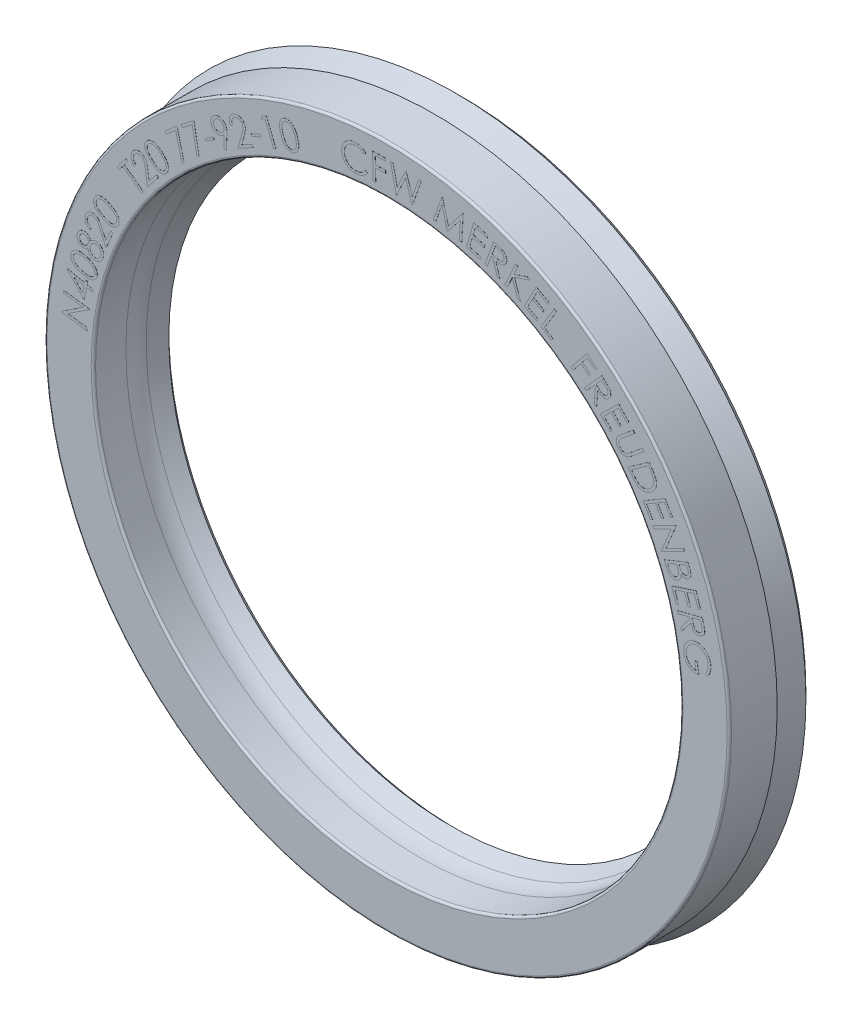
from build123d import *

# Parameters (mm, degrees)
BOSS_EXTRUDE1_DEPTH = 0.01


with BuildPart() as part:
    # Sketch1 → Revolve1 (revolve)
    with BuildSketch(Plane(origin=(0, 0, 0), x_dir=(0, 0, -1), z_dir=(1, 0, 0))):
        with BuildLine():
            Line((0, 40.2), (0, 46.2))
            ThreePointArc((0, 46.2), (0.087867966, 46.412132034), (0.3, 46.5))
            Line((0.3, 46.5), (6.5, 46.5))
            Line((6.5, 46.5), (9.4, 47.5))
            Line((9.4, 47.5), (10.2, 46.7))
            Line((10.2, 46.7), (10.2, 45.25))
            Line((10.2, 45.25), (6.737932233, 43.715696649))
            ThreePointArc((6.737932233, 43.715696649), (6.500192845, 43.362419293), (6.715547175, 42.995067393))
            Line((6.715547175, 42.995067393), (9.4, 41.6))
            Line((9.4, 41.6), (9.4, 39.05))
            Line((9.4, 39.05), (8.7, 38.35))
            Line((8.7, 38.35), (6.65572809, 39.372135955))
            ThreePointArc((6.65572809, 39.372135955), (5.568424715, 39.766244947), (4.419660113, 39.9))
            Line((4.419660113, 39.9), (0.3, 39.9))
            ThreePointArc((0.3, 39.9), (0.087867966, 39.987867966), (0, 40.2))
        make_face()
    revolve(axis=Axis((0, 0, 0), (0, 0, -1)))

    # Sketch2 → Boss-Extrude1 (add)
    # profile 1 of 37: a face of its own
    with BuildSketch(Plane.XY):
        Polygon((-40.795560333, 3.923111163), (-44.244378442, 4.37112799), (-44.234562737, 4.446148022), (-41.296862416, 6.395967734), (-43.936585974, 6.738816291), (-43.892415301, 7.078860362), (-40.443597192, 6.630843535), (-40.453412897, 6.553720138), (-43.356057128, 4.617922862), (-40.749286295, 4.279281035), align=None)
    # profile 2 of 37: a face of its own
    with BuildSketch(Plane.XY):
        Polygon((-43.466249145, 9.817248604), (-43.451525587, 9.886659662), (-41.071217094, 9.388863187), (-40.984979113, 9.802525046), (-40.657555235, 9.734516232), (-40.743793215, 9.320854373), (-39.949422222, 9.154688508), (-40.020936645, 8.813242194), (-40.815307639, 8.979408059), (-41.156753953, 7.346495399), align=None)
        Polygon((-41.142731517, 9.047416873), (-42.566709882, 9.345393636), (-41.353068055, 8.042008219), align=None, mode=Mode.SUBTRACT)
    # profile 3 of 37: a face of its own
    with BuildSketch(Plane.XY):
        with BuildLine():
            add(Edge.make_bspline(
                [(-41.471303451, 10.308803277), (-41.524925982, 10.324116529), (-41.629150032, 10.353880308), (-41.779092328, 10.402879294), (-41.918154009, 10.454104638), (-42.046712456, 10.506853342), (-42.165479611, 10.560057472), (-42.272715712, 10.616946492), (-42.369251718, 10.675428405), (-42.456512441, 10.734832386), (-42.533627062, 10.798275906), (-42.605211067, 10.861926309), (-42.669444215, 10.928425875), (-42.727522104, 10.997057956), (-42.77948934, 11.067541071), (-42.824426259, 11.140528727), (-42.862539173, 11.215698362), (-42.894805546, 11.292200993), (-42.919989596, 11.370399909), (-42.93907231, 11.449135811), (-42.95161353, 11.528155763), (-42.95807784, 11.607387125), (-42.957960418, 11.686861191), (-42.951855965, 11.7668627), (-42.938310518, 11.846959859), (-42.925079363, 11.899727947), (-42.918418836, 11.926291258)],
                knots=[0, 0, 0, 0, 1.644537594, 3.196424473, 4.650926029, 6.014062476, 7.294091482, 8.487300661, 9.591340167, 10.621846909, 11.597097219, 12.534114708, 13.445612672, 14.321061531, 15.184049404, 16.025718074, 16.84565817, 17.667450193, 18.471742533, 19.265810654, 20.054476072, 20.828918089, 21.607764204, 22.395947589, 23.192524432, 24, 24, 24, 24], degree=3))
            add(Edge.make_bspline(
                [(-42.918418836, 11.926291258), (-42.910471501, 11.953094614), (-42.894771618, 12.006044385), (-42.863197917, 12.082255327), (-42.827102446, 12.155035347), (-42.785084892, 12.224064631), (-42.739297264, 12.290519913), (-42.686117863, 12.351959332), (-42.628551576, 12.410345655), (-42.566013445, 12.465270982), (-42.498256483, 12.515855759), (-42.424743826, 12.56031624), (-42.347511301, 12.601698796), (-42.264568897, 12.636567086), (-42.176445936, 12.665623533), (-42.083944967, 12.691312637), (-41.986143869, 12.710441924), (-41.883491877, 12.725630109), (-41.774806652, 12.733663631), (-41.659843137, 12.736118272), (-41.538182285, 12.729656622), (-41.409653756, 12.71813021), (-41.274508367, 12.698010939), (-41.132802149, 12.67125902), (-40.984529646, 12.637555554), (-40.884140524, 12.610473047), (-40.832581496, 12.596563694)],
                knots=[0, 0, 0, 0, 0.818211677, 1.616369223, 2.412175784, 3.195075315, 3.981169332, 4.772519377, 5.571058304, 6.381012997, 7.207795849, 8.043566502, 8.894665521, 9.771784761, 10.67430401, 11.610727053, 12.581172682, 13.590701394, 14.647894663, 15.77052214, 16.95582443, 18.213695518, 19.548444079, 20.955211321, 22.436221566, 24, 24, 24, 24], degree=3))
            add(Edge.make_bspline(
                [(-40.832581496, 12.596563694), (-40.781530647, 12.58170541), (-40.682009781, 12.55273999), (-40.538260362, 12.504860133), (-40.403494376, 12.45557104), (-40.278373066, 12.402822022), (-40.162554174, 12.34780099), (-40.056471972, 12.289400149), (-39.959479146, 12.229164494), (-39.871080519, 12.166810312), (-39.791994398, 12.100765457), (-39.718257539, 12.034563853), (-39.652721165, 11.964742949), (-39.592604881, 11.89408694), (-39.539768788, 11.820983914), (-39.494373569, 11.745682421), (-39.454332879, 11.668993391), (-39.422608057, 11.58983399), (-39.396619487, 11.509954286), (-39.376550215, 11.429672384), (-39.364233063, 11.349149456), (-39.357710521, 11.268301204), (-39.35779685, 11.187418516), (-39.364041431, 11.106041569), (-39.37732098, 11.024667836), (-39.391129829, 10.971037129), (-39.398086304, 10.944019623)],
                knots=[0, 0, 0, 0, 1.558754841, 3.038708114, 4.441391835, 5.764921375, 7.018434073, 8.199113329, 9.313298977, 10.364741178, 11.367545718, 12.332726382, 13.268164013, 14.172699665, 15.05129916, 15.909159826, 16.74884875, 17.58483908, 18.406097149, 19.210458959, 20.008050347, 20.791625933, 21.586475283, 22.376881948, 23.182322911, 24, 24, 24, 24], degree=3))
            add(Edge.make_bspline(
                [(-39.398086304, 10.944019623), (-39.406103111, 10.917706833), (-39.421978182, 10.865601627), (-39.452535724, 10.790496578), (-39.487233058, 10.71863697), (-39.528549317, 10.650924166), (-39.574474403, 10.586489509), (-39.626361842, 10.526036569), (-39.682137115, 10.468137466), (-39.744174507, 10.415091023), (-39.810419979, 10.365851453), (-39.88206996, 10.322395462), (-39.957657627, 10.282815395), (-40.038436328, 10.249277501), (-40.123947105, 10.221506755), (-40.213659399, 10.197241813), (-40.308653877, 10.179497123), (-40.408513569, 10.165801852), (-40.514862418, 10.158824148), (-40.62841961, 10.159189347), (-40.749934013, 10.166127956), (-40.87895977, 10.181548183), (-41.016040787, 10.202560773), (-41.161108165, 10.23059253), (-41.313853699, 10.266712592), (-41.417853567, 10.294514641), (-41.471303451, 10.308803277)],
                knots=[0, 0, 0, 0, 0.811672784, 1.607293537, 2.391039138, 3.164882852, 3.946073349, 4.724364037, 5.514762432, 6.31699684, 7.1311583, 7.948820292, 8.788171649, 9.647946393, 10.527210454, 11.440961176, 12.389500477, 13.377950059, 14.415161165, 15.53286812, 16.728461148, 18.006196778, 19.367413418, 20.8220146, 22.36670032, 24, 24, 24, 24], degree=3))
        make_face()
        with BuildLine():
            add(Edge.make_bspline(
                [(-41.375950887, 10.623606963), (-41.329992036, 10.610901763), (-41.241193252, 10.586353579), (-41.110771757, 10.555854865), (-40.988481344, 10.529240081), (-40.873494641, 10.510034666), (-40.766721451, 10.494868921), (-40.667539027, 10.485253395), (-40.575976378, 10.482654343), (-40.491464338, 10.484509005), (-40.412726482, 10.491396851), (-40.338414243, 10.503736129), (-40.266996807, 10.518693042), (-40.199663957, 10.53914081), (-40.135441353, 10.562931787), (-40.075527057, 10.591976007), (-40.018051301, 10.623954178), (-39.948580761, 10.67310953), (-39.870627656, 10.740520005), (-39.7932338, 10.83142644), (-39.73365421, 10.931200502), (-39.70953049, 11.003308343), (-39.69746531, 11.039372187)],
                knots=[0, 0, 0, 0, 1.480115797, 2.85978607, 4.157531061, 5.364616841, 6.477896922, 7.505232383, 8.45611903, 9.319773482, 10.128372802, 10.90726178, 11.657229126, 12.391771786, 13.089790014, 13.781025871, 14.456859643, 15.129101021, 16.41974851, 17.645055973, 18.822203873, 20, 20, 20, 20], degree=3))
            add(Edge.make_bspline(
                [(-39.69746531, 11.039372187), (-39.688837174, 11.076568434), (-39.671578141, 11.150972829), (-39.670589541, 11.266806294), (-39.688458284, 11.383448721), (-39.719713828, 11.479678294), (-39.753510012, 11.555864356), (-39.784523833, 11.612673454), (-39.821876944, 11.666975709), (-39.864198494, 11.720026056), (-39.91212171, 11.770990747), (-39.964932217, 11.821242645), (-40.02362693, 11.869364402), (-40.065832388, 11.899202787), (-40.087289028, 11.914372187)],
                knots=[0, 0, 0, 0, 1.336924216, 2.674276204, 4.035146342, 5.464603756, 6.210059763, 6.959028055, 7.732614275, 8.520508226, 9.338900614, 10.186099486, 11.077839381, 12, 12, 12, 12], degree=3))
            add(Edge.make_bspline(
                [(-40.087289028, 11.914372187), (-40.11486845, 11.933200237), (-40.170828755, 11.971403482), (-40.260609455, 12.022828751), (-40.355321982, 12.072627831), (-40.455550949, 12.12070138), (-40.562115291, 12.164314989), (-40.674160424, 12.205822337), (-40.791481166, 12.245110509), (-40.872224353, 12.268490048), (-40.913210503, 12.280357764)],
                knots=[0, 0, 0, 0, 0.882735854, 1.79112415, 2.733784536, 3.712367262, 4.729230593, 5.777333525, 6.871749495, 8, 8, 8, 8], degree=3))
            add(Edge.make_bspline(
                [(-40.913210503, 12.280357764), (-40.954493957, 12.291671063), (-41.035095664, 12.313759116), (-41.154797269, 12.340657995), (-41.269194061, 12.364196376), (-41.379114185, 12.381963225), (-41.484191687, 12.393763891), (-41.584774354, 12.400984143), (-41.680475171, 12.40314345), (-41.771550371, 12.400601926), (-41.857590249, 12.392489901), (-41.939217113, 12.381914034), (-42.015988883, 12.36554575), (-42.08803849, 12.345193479), (-42.156107936, 12.321674945), (-42.218868599, 12.292626255), (-42.277872536, 12.260751019), (-42.347244043, 12.2113137), (-42.424976913, 12.144824101), (-42.500671953, 12.053842708), (-42.560431514, 11.955620687), (-42.584110278, 11.884090372), (-42.59590281, 11.848466739)],
                knots=[0, 0, 0, 0, 1.329307553, 2.595336499, 3.809618473, 4.956418996, 6.0521893, 7.092713627, 8.087389445, 9.024207571, 9.920586861, 10.770564097, 11.579180939, 12.355892261, 13.095136836, 13.813011328, 14.501820229, 15.174374047, 16.45537974, 17.666359549, 18.837796916, 20, 20, 20, 20], degree=3))
            add(Edge.make_bspline(
                [(-42.59590281, 11.848466739), (-42.604220859, 11.811260942), (-42.620869189, 11.736794635), (-42.622298939, 11.620513005), (-42.603268495, 11.503072241), (-42.572224432, 11.40564314), (-42.538559422, 11.328300394), (-42.506853543, 11.271247876), (-42.469024703, 11.216476741), (-42.427313021, 11.162483689), (-42.380093821, 11.110558979), (-42.327814023, 11.060480403), (-42.270110487, 11.01212906), (-42.206627555, 10.96479693), (-42.135588259, 10.918637264), (-42.055342585, 10.874005054), (-41.965760535, 10.829907371), (-41.866213818, 10.787502474), (-41.757783969, 10.744366201), (-41.638826119, 10.703670733), (-41.510992043, 10.66188154), (-41.42185243, 10.63661679), (-41.375950887, 10.623606963)],
                knots=[0, 0, 0, 0, 1.181172327, 2.364081705, 3.583242951, 4.86145294, 5.527454553, 6.199789628, 6.884039103, 7.592333799, 8.316651299, 9.060759795, 9.838359033, 10.652474383, 11.517873532, 12.466481501, 13.501634495, 14.616351765, 15.824973827, 17.123797317, 18.518928519, 20, 20, 20, 20], degree=3))
        make_face(mode=Mode.SUBTRACT)
    # profile 4 of 37: a face of its own
    with BuildSketch(Plane.XY):
        with BuildLine():
            add(Edge.make_bspline(
                [(-40.302045101, 14.679567488), (-40.278828134, 14.701466599), (-40.233427465, 14.744290207), (-40.164326853, 14.804268828), (-40.094753888, 14.856486333), (-40.026564271, 14.903407158), (-39.958884771, 14.943315636), (-39.891502779, 14.976490872), (-39.825235226, 15.004273813), (-39.737412046, 15.030950376), (-39.626782697, 15.051832972), (-39.4923364, 15.055721174), (-39.356511029, 15.040323458), (-39.268957846, 15.013118013), (-39.224420902, 14.999279026)],
                knots=[0, 0, 0, 0, 0.963384241, 1.883893324, 2.760083596, 3.58775866, 4.381454875, 5.129174833, 5.853636894, 6.547609191, 7.896659997, 9.237700214, 10.594861011, 12, 12, 12, 12], degree=3))
            add(Edge.make_bspline(
                [(-39.224420902, 14.999279026), (-39.19331492, 14.987729278), (-39.132008614, 14.964966055), (-39.045218814, 14.920629815), (-38.963821964, 14.870226059), (-38.887590586, 14.813217452), (-38.817097098, 14.74915707), (-38.752808107, 14.677731952), (-38.692293802, 14.600898958), (-38.658278464, 14.544639091), (-38.641087569, 14.51620611)],
                knots=[0, 0, 0, 0, 1.028040584, 2.026149538, 3.015460684, 3.993696853, 4.973434784, 5.963409141, 6.970734342, 8, 8, 8, 8], degree=3))
            add(Edge.make_bspline(
                [(-38.641087569, 14.51620611), (-38.621686157, 14.480183762), (-38.583155543, 14.408644477), (-38.542109416, 14.29385565), (-38.514433644, 14.175294583), (-38.501259486, 14.052419613), (-38.502070162, 13.925418216), (-38.517681861, 13.794297457), (-38.544976153, 13.658499983), (-38.574682234, 13.568723952), (-38.589905678, 13.522716526)],
                knots=[0, 0, 0, 0, 0.954072467, 1.89475885, 2.835761644, 3.79076972, 4.772886505, 5.794172515, 6.869581964, 8, 8, 8, 8], degree=3))
            add(Edge.make_bspline(
                [(-38.589905678, 13.522716526), (-38.606247153, 13.478948948), (-38.638060525, 13.393742791), (-38.696457526, 13.274265732), (-38.761655172, 13.166500511), (-38.833508697, 13.07020986), (-38.912189869, 12.985443285), (-38.998264925, 12.912558257), (-39.091509325, 12.851946994), (-39.190273287, 12.803344733), (-39.291493968, 12.765255861), (-39.392756368, 12.736090152), (-39.493266598, 12.717239546), (-39.592492673, 12.707265864), (-39.690648775, 12.706313187), (-39.787652127, 12.715539107), (-39.883745058, 12.734394209), (-39.946039292, 12.754149307), (-39.97742571, 12.764102744)],
                knots=[0, 0, 0, 0, 1.265682677, 2.464014674, 3.598164907, 4.675005194, 5.714765919, 6.726142392, 7.724079708, 8.721232679, 9.703568349, 10.65196742, 11.573784702, 12.471320508, 13.351818587, 14.229829603, 15.10811477, 16, 16, 16, 16], degree=3))
            add(Edge.make_bspline(
                [(-39.97742571, 12.764102744), (-40.000013582, 12.77238572), (-40.04469852, 12.788771691), (-40.108358753, 12.819431785), (-40.16934454, 12.852748771), (-40.225947205, 12.891871894), (-40.279992983, 12.933764409), (-40.331142692, 12.979445883), (-40.377619346, 13.030396646), (-40.422511873, 13.084141192), (-40.462624716, 13.144061028), (-40.499618111, 13.208859396), (-40.532806324, 13.2793842), (-40.561064454, 13.355640499), (-40.587556386, 13.43704336), (-40.608602245, 13.524607975), (-40.62717075, 13.617429517), (-40.636105703, 13.681349192), (-40.640686928, 13.714122776)],
                knots=[0, 0, 0, 0, 0.938716184, 1.85703524, 2.75565247, 3.648973558, 4.539634767, 5.424670098, 6.322035803, 7.229778155, 8.15599542, 9.132655155, 10.140813898, 11.194832227, 12.305761026, 13.480820111, 14.708338937, 16, 16, 16, 16], degree=3))
            add(Edge.make_bspline(
                [(-40.640686928, 13.714122776), (-40.675251051, 13.683068346), (-40.742059355, 13.623043856), (-40.85140088, 13.550285689), (-40.962591545, 13.494506258), (-41.076249546, 13.458039476), (-41.189552697, 13.438214055), (-41.301703568, 13.434357669), (-41.412225539, 13.447447074), (-41.482976375, 13.468619153), (-41.518491415, 13.479246975)],
                knots=[0, 0, 0, 0, 1.162840131, 2.247630498, 3.279339837, 4.269973985, 5.226808512, 6.152390694, 7.072549205, 8, 8, 8, 8], degree=3))
            add(Edge.make_bspline(
                [(-41.518491415, 13.479246975), (-41.553615686, 13.493358315), (-41.624188046, 13.521711092), (-41.721598342, 13.584681663), (-41.812696721, 13.661377211), (-41.894859658, 13.753419039), (-41.96694131, 13.856790277), (-42.023994604, 13.970998105), (-42.066434733, 14.093255654), (-42.092682643, 14.222696531), (-42.103130551, 14.35598393), (-42.097325903, 14.490100743), (-42.076088807, 14.62381742), (-42.048937017, 14.710226795), (-42.035218178, 14.753886398)],
                knots=[0, 0, 0, 0, 0.892985684, 1.794204021, 2.727185645, 3.701184705, 4.701843963, 5.697488885, 6.709052973, 7.752399486, 8.810803876, 9.861365017, 10.919423334, 12, 12, 12, 12], degree=3))
            add(Edge.make_bspline(
                [(-42.035218178, 14.753886398), (-42.019279406, 14.795538193), (-41.987714887, 14.878023775), (-41.921170466, 14.991561415), (-41.843495089, 15.096380342), (-41.752552494, 15.189457113), (-41.652392579, 15.270758024), (-41.543905575, 15.33683029), (-41.428942021, 15.386759567), (-41.309177194, 15.421107311), (-41.187747168, 15.439235069), (-41.067743143, 15.441729689), (-40.950164654, 15.427375244), (-40.875304489, 15.404699516), (-40.837702152, 15.393309475)],
                knots=[0, 0, 0, 0, 1.064747761, 2.10858472, 3.134558943, 4.177842321, 5.211140746, 6.21167446, 7.205192512, 8.199213325, 9.182336363, 10.13245984, 11.061932674, 12, 12, 12, 12], degree=3))
            add(Edge.make_bspline(
                [(-40.837702152, 15.393309475), (-40.801896248, 15.379438602), (-40.731305401, 15.352092366), (-40.635689618, 15.292842173), (-40.550570618, 15.222020796), (-40.478118901, 15.137492424), (-40.416604233, 15.040820862), (-40.366158467, 14.931904822), (-40.326536501, 14.810437137), (-40.310399339, 14.724208308), (-40.302045101, 14.679567488)],
                knots=[0, 0, 0, 0, 0.977189525, 1.926515721, 2.852672125, 3.790428196, 4.752385388, 5.765306919, 6.843095377, 8, 8, 8, 8], degree=3))
        make_face()
        with BuildLine():
            add(Edge.make_bspline(
                [(-41.721115614, 14.626983353), (-41.728256217, 14.604646374), (-41.742254931, 14.560856101), (-41.756704478, 14.494691023), (-41.766676087, 14.429818728), (-41.767917937, 14.36592), (-41.765999527, 14.302932707), (-41.755619314, 14.241248642), (-41.740228671, 14.180710619), (-41.719400457, 14.121875024), (-41.692788513, 14.066511478), (-41.66292778, 14.015079953), (-41.628716078, 13.96888325), (-41.590897631, 13.927251296), (-41.548602071, 13.890762052), (-41.502755997, 13.859091724), (-41.453309417, 13.831868123), (-41.41794813, 13.818409252), (-41.400001832, 13.811578706)],
                knots=[0, 0, 0, 0, 1.153538859, 2.261441972, 3.330198732, 4.377508778, 5.402278286, 6.427241445, 7.448324603, 8.47431995, 9.493068015, 10.467608153, 11.397048109, 12.317044619, 13.230329159, 14.139693695, 15.05587113, 16, 16, 16, 16], degree=3))
            add(Edge.make_bspline(
                [(-41.400001832, 13.811578706), (-41.381649269, 13.805785265), (-41.345181523, 13.79427332), (-41.288669899, 13.784461517), (-41.231469567, 13.781755805), (-41.173716352, 13.785557027), (-41.114900709, 13.794534323), (-41.055350242, 13.81064246), (-40.99556353, 13.834672552), (-40.935120913, 13.862577011), (-40.877141289, 13.896711477), (-40.822653738, 13.934532521), (-40.773298835, 13.97679689), (-40.729144283, 14.023251912), (-40.689406394, 14.073293158), (-40.655243803, 14.127510027), (-40.625202887, 14.185299774), (-40.609888124, 14.226228827), (-40.602125229, 14.24697534)],
                knots=[0, 0, 0, 0, 0.920978646, 1.830044928, 2.737800968, 3.657350104, 4.597714231, 5.583353787, 6.603964768, 7.680494658, 8.769003399, 9.82170224, 10.853666578, 11.874952505, 12.887119625, 13.908712198, 14.939947833, 16, 16, 16, 16], degree=3))
            add(Edge.make_bspline(
                [(-40.602125229, 14.24697534), (-40.593686673, 14.274141345), (-40.576824992, 14.328423676), (-40.564628764, 14.412707022), (-40.563034918, 14.498263991), (-40.57332615, 14.583621252), (-40.59213019, 14.667547007), (-40.623004245, 14.74675323), (-40.662660722, 14.8211431), (-40.713746972, 14.887828291), (-40.770167062, 14.947662735), (-40.831810504, 14.997825182), (-40.89672758, 15.039077532), (-40.943469004, 15.057919651), (-40.966708563, 15.06728784)],
                knots=[0, 0, 0, 0, 1.030389626, 2.058894967, 3.076162545, 4.125448568, 5.16989638, 6.186775451, 7.199442067, 8.216568387, 9.223757436, 10.175569466, 11.092903948, 12, 12, 12, 12], degree=3))
            add(Edge.make_bspline(
                [(-40.966708563, 15.06728784), (-40.983435616, 15.072587655), (-41.01648029, 15.083057559), (-41.067838336, 15.091885115), (-41.119697733, 15.096326108), (-41.172604266, 15.094854727), (-41.226058445, 15.087545813), (-41.280534317, 15.075595971), (-41.335709108, 15.058072362), (-41.390888608, 15.034964393), (-41.444935178, 15.006657924), (-41.495643587, 14.971185856), (-41.542941077, 14.929787439), (-41.585743828, 14.881237591), (-41.625969143, 14.827401717), (-41.661718621, 14.766338517), (-41.693867613, 14.699171182), (-41.711886039, 14.651435165), (-41.721115614, 14.626983353)],
                knots=[0, 0, 0, 0, 0.862708486, 1.704300156, 2.558299253, 3.421314425, 4.303060835, 5.21010444, 6.163240073, 7.148055389, 8.151503997, 9.159819594, 10.186728611, 11.237518722, 12.339506641, 13.489612068, 14.714104455, 16, 16, 16, 16], degree=3))
        make_face(mode=Mode.SUBTRACT)
        with BuildLine():
            add(Edge.make_bspline(
                [(-40.302746223, 14.147416046), (-40.311952808, 14.119290764), (-40.330007049, 14.064136696), (-40.347116423, 13.980181866), (-40.357537646, 13.89765019), (-40.358604146, 13.815906279), (-40.352682462, 13.735049335), (-40.337440263, 13.655310814), (-40.315268203, 13.576467223), (-40.284193741, 13.499998213), (-40.247511789, 13.426988879), (-40.205623385, 13.359334168), (-40.158010368, 13.298578804), (-40.106423672, 13.243767705), (-40.049438742, 13.195445244), (-39.987950291, 13.153506814), (-39.921445209, 13.117844701), (-39.87434813, 13.099902234), (-39.850522665, 13.090825501)],
                knots=[0, 0, 0, 0, 1.111403163, 2.17947709, 3.214497478, 4.233554515, 5.24676511, 6.256314036, 7.279451247, 8.320084363, 9.353202173, 10.347581786, 11.305162864, 12.249560475, 13.171803894, 14.107336808, 15.042539786, 16, 16, 16, 16], degree=3))
            add(Edge.make_bspline(
                [(-39.850522665, 13.090825501), (-39.820358537, 13.081485748), (-39.760211518, 13.06286236), (-39.665970766, 13.051485633), (-39.570297492, 13.053153516), (-39.474003538, 13.066923936), (-39.379260983, 13.094212561), (-39.289154727, 13.134890202), (-39.205192303, 13.189424296), (-39.127412608, 13.255944016), (-39.05713276, 13.33527041), (-38.994865304, 13.425185967), (-38.940723355, 13.525799851), (-38.913234813, 13.59831192), (-38.89910039, 13.635597135)],
                knots=[0, 0, 0, 0, 0.925763198, 1.84596406, 2.772566353, 3.729550523, 4.693937893, 5.658374102, 6.621637506, 7.624335626, 8.654786841, 9.72472767, 10.830070336, 12, 12, 12, 12], degree=3))
            add(Edge.make_bspline(
                [(-38.89910039, 13.635597135), (-38.889456418, 13.665129341), (-38.870671149, 13.722654438), (-38.85189382, 13.809800495), (-38.840308906, 13.894420904), (-38.837371008, 13.976884321), (-38.84294052, 14.056802192), (-38.856977117, 14.13442006), (-38.879713002, 14.209744687), (-38.909718008, 14.282237274), (-38.946126889, 14.350628866), (-38.987301034, 14.414060626), (-39.033995103, 14.471041188), (-39.084662171, 14.522465254), (-39.139472638, 14.568590947), (-39.199710225, 14.607850775), (-39.264252895, 14.641812681), (-39.309996187, 14.659445598), (-39.333094781, 14.668349539)],
                knots=[0, 0, 0, 0, 1.19035832, 2.318671247, 3.41226184, 4.461187904, 5.476195878, 6.477948213, 7.478618071, 8.486960296, 9.480989401, 10.445214402, 11.381389343, 12.300078709, 13.209811034, 14.121834881, 15.05159921, 16, 16, 16, 16], degree=3))
            add(Edge.make_bspline(
                [(-39.333094781, 14.668349539), (-39.355858837, 14.675644474), (-39.401254711, 14.690191965), (-39.471442503, 14.702682758), (-39.541995282, 14.706595317), (-39.612959563, 14.703943594), (-39.684408581, 14.69332978), (-39.756460001, 14.674814611), (-39.828926495, 14.648616001), (-39.900904508, 14.615263524), (-39.970668513, 14.575870754), (-40.035243342, 14.530014116), (-40.09449322, 14.479643468), (-40.147515364, 14.423455709), (-40.19542016, 14.362358829), (-40.23749135, 14.295664374), (-40.273408311, 14.223587337), (-40.292868707, 14.173061468), (-40.302746223, 14.147416046)],
                knots=[0, 0, 0, 0, 0.940806508, 1.876147761, 2.79835052, 3.719633926, 4.668690921, 5.637673505, 6.645157708, 7.699576187, 8.759165675, 9.796120387, 10.814563557, 11.817326469, 12.833812414, 13.868148756, 14.917935947, 16, 16, 16, 16], degree=3))
        make_face(mode=Mode.SUBTRACT)
    # profile 5 of 37: a face of its own
    with BuildSketch(Plane.XY):
        with BuildLine():
            Line((-40.196620846, 16.275665089), (-40.3270295, 15.969975987))
            add(Edge.make_bspline(
                [(-40.3270295, 15.969975987), (-40.364754038, 15.988522244), (-40.438754989, 16.024902827), (-40.542319625, 16.089116931), (-40.636568614, 16.160092091), (-40.722049337, 16.237514458), (-40.798282658, 16.321829637), (-40.864381226, 16.41390196), (-40.922030325, 16.512186831), (-40.970168161, 16.616203775), (-41.007925213, 16.723757283), (-41.03475677, 16.832932454), (-41.050514416, 16.942614706), (-41.053816253, 17.052618363), (-41.046089074, 17.162801716), (-41.026726965, 17.273306991), (-40.997086557, 17.384691966), (-40.967936684, 17.456859341), (-40.953131263, 17.493513647)],
                knots=[0, 0, 0, 0, 1.099132338, 2.156072484, 3.181914841, 4.181629957, 5.168609088, 6.149358284, 7.141247977, 8.145085647, 9.142761194, 10.118409698, 11.081547271, 12.03573756, 12.991806102, 13.965710065, 14.96677014, 16, 16, 16, 16], degree=3))
            add(Edge.make_bspline(
                [(-40.953131263, 17.493513647), (-40.936982746, 17.529151891), (-40.90547082, 17.59869572), (-40.847683563, 17.695194623), (-40.784949813, 17.783869133), (-40.71362235, 17.862097686), (-40.63693537, 17.932595102), (-40.552733474, 17.99274039), (-40.462805733, 18.045473754), (-40.366266485, 18.086495397), (-40.267333361, 18.119543157), (-40.167563245, 18.142674787), (-40.068045699, 18.156573116), (-39.968919803, 18.158784005), (-39.870175048, 18.153152055), (-39.772266868, 18.135348552), (-39.674162365, 18.11027248), (-39.610938559, 18.084822674), (-39.578932545, 18.071939128)],
                knots=[0, 0, 0, 0, 1.126970372, 2.199149721, 3.236804651, 4.252802558, 5.244774786, 6.233883445, 7.229919184, 8.243658794, 9.251314004, 10.233423622, 11.191889272, 12.142151886, 13.087242443, 14.037505056, 15.006519138, 16, 16, 16, 16], degree=3))
            add(Edge.make_bspline(
                [(-39.578932545, 18.071939128), (-39.534846314, 18.05133914), (-39.44766103, 18.010600439), (-39.327897738, 17.929630259), (-39.219551927, 17.83472169), (-39.138375112, 17.742742499), (-39.077674628, 17.658993158), (-39.028951292, 17.586448621), (-38.978850182, 17.503635226), (-38.926357448, 17.410995041), (-38.871601398, 17.308740457), (-38.815758286, 17.195938154), (-38.756835974, 17.073924088), (-38.718232837, 16.988560755), (-38.698323571, 16.944535282)],
                knots=[0, 0, 0, 0, 1.191820857, 2.356954475, 3.530668843, 4.716258691, 5.355893854, 6.066419838, 6.858648675, 7.728748487, 8.677425357, 9.7026476, 10.815158412, 12, 12, 12, 12], degree=3))
            Line((-38.698323571, 16.944535282), (-38.180194564, 15.784879833))
            Line((-38.180194564, 15.784879833), (-37.551989436, 17.257235602))
            Line((-37.551989436, 17.257235602), (-37.244196968, 17.126125827))
            Line((-37.244196968, 17.126125827), (-38.168275494, 14.95965948))
            Line((-38.168275494, 14.95965948), (-38.965450975, 16.739807718))
            add(Edge.make_bspline(
                [(-38.965450975, 16.739807718), (-38.984718767, 16.783102532), (-39.02179985, 16.86642389), (-39.077192034, 16.985284641), (-39.128897368, 17.093469853), (-39.177872441, 17.190674809), (-39.224961841, 17.276637408), (-39.268151915, 17.35231004), (-39.307964432, 17.417530381), (-39.357738527, 17.488627179), (-39.422140779, 17.565243876), (-39.507513563, 17.643976978), (-39.602053693, 17.709349012), (-39.670756684, 17.742133098), (-39.705134468, 17.758537686)],
                knots=[0, 0, 0, 0, 1.321589254, 2.543413364, 3.657024482, 4.665580406, 5.578492579, 6.390162644, 7.095563049, 7.708549043, 8.80930646, 9.879537851, 10.938957539, 12, 12, 12, 12], degree=3))
            add(Edge.make_bspline(
                [(-39.705134468, 17.758537686), (-39.727396674, 17.767465876), (-39.771198851, 17.785032608), (-39.839311984, 17.802259926), (-39.907597982, 17.813223692), (-39.976513346, 17.815733507), (-40.045570658, 17.811588666), (-40.114817211, 17.800113828), (-40.184613015, 17.781833403), (-40.253844507, 17.756126334), (-40.320732104, 17.723821299), (-40.384151628, 17.687090596), (-40.44205696, 17.643842526), (-40.494964121, 17.59503692), (-40.543273719, 17.541004003), (-40.5871785, 17.481912623), (-40.625165916, 17.416758399), (-40.646422282, 17.37053957), (-40.657257866, 17.346979192)],
                knots=[0, 0, 0, 0, 0.997333482, 1.962311319, 2.91708633, 3.871167356, 4.826239636, 5.792148564, 6.787820337, 7.825011615, 8.860513768, 9.876505547, 10.870655612, 11.861993904, 12.867735879, 13.883308471, 14.921001392, 16, 16, 16, 16], degree=3))
            add(Edge.make_bspline(
                [(-40.657257866, 17.346979192), (-40.667322416, 17.32167341), (-40.687074127, 17.272010736), (-40.707991106, 17.195863942), (-40.721580555, 17.120533474), (-40.727203691, 17.045594552), (-40.725353447, 16.970809605), (-40.714432427, 16.89666426), (-40.696828889, 16.822898975), (-40.671655485, 16.750260295), (-40.63888925, 16.679325073), (-40.597553011, 16.61188299), (-40.550010149, 16.54665131), (-40.493407258, 16.486238504), (-40.430517338, 16.427856296), (-40.359591055, 16.373654133), (-40.28136861, 16.322022449), (-40.225369711, 16.291390832), (-40.196620846, 16.275665089)],
                knots=[0, 0, 0, 0, 1.00640724, 1.975077231, 2.914231271, 3.832883438, 4.749297221, 5.674470622, 6.598836435, 7.549922488, 8.512637565, 9.481924151, 10.470587707, 11.491984619, 12.537803722, 13.640626591, 14.788738541, 16, 16, 16, 16], degree=3))
        make_face()
    # profile 6 of 37: a face of its own
    with BuildSketch(Plane.XY):
        with BuildLine():
            add(Edge.make_bspline(
                [(-38.645200515, 18.223615653), (-38.694710386, 18.248955846), (-38.790803553, 18.298138348), (-38.927429127, 18.375777502), (-39.054032282, 18.451581996), (-39.169075029, 18.528580931), (-39.274596705, 18.603622109), (-39.368826811, 18.679603791), (-39.452432529, 18.754969297), (-39.525526005, 18.830859434), (-39.5895488, 18.907039873), (-39.646654947, 18.983473118), (-39.696461525, 19.060952599), (-39.740462316, 19.138840404), (-39.776743805, 19.217980968), (-39.806476037, 19.297900563), (-39.829823509, 19.378460179), (-39.845739428, 19.459915499), (-39.855636029, 19.541003347), (-39.859112721, 19.621392159), (-39.85672312, 19.700957721), (-39.846046291, 19.779507458), (-39.83218503, 19.85763478), (-39.809741152, 19.934330255), (-39.782133266, 20.010261112), (-39.758540848, 20.059102014), (-39.746662854, 20.083691775)],
                knots=[0, 0, 0, 0, 1.646526817, 3.195725909, 4.651817692, 6.0144138, 7.293395697, 8.484288219, 9.596276489, 10.623968799, 11.601199408, 12.540888206, 13.446825458, 14.32659292, 15.18732364, 16.021499615, 16.849366569, 17.667664167, 18.476160735, 19.265751773, 20.048154593, 20.829179268, 21.610878007, 22.395023, 23.191947718, 24, 24, 24, 24], degree=3))
            add(Edge.make_bspline(
                [(-39.746662854, 20.083691775), (-39.733721919, 20.108214312), (-39.708009066, 20.156939104), (-39.662989937, 20.225701284), (-39.612850011, 20.289566852), (-39.559022504, 20.34940271), (-39.500349565, 20.404158158), (-39.437945645, 20.455096086), (-39.370118094, 20.500629251), (-39.29799695, 20.541948237), (-39.221782186, 20.578520784), (-39.141540476, 20.608714284), (-39.057521759, 20.632522311), (-38.96964404, 20.650664674), (-38.878074917, 20.663352603), (-38.782718274, 20.66936236), (-38.683690995, 20.670151961), (-38.580409842, 20.664488724), (-38.472683327, 20.651734419), (-38.360021748, 20.631281812), (-38.242450955, 20.602101685), (-38.119169921, 20.565761852), (-37.991298815, 20.519644064), (-37.857844739, 20.466458297), (-37.719630033, 20.404413308), (-37.626571424, 20.358808457), (-37.578794265, 20.3353945)],
                knots=[0, 0, 0, 0, 0.814865698, 1.619088629, 2.412139202, 3.200173441, 3.982767195, 4.76933231, 5.565917007, 6.38150658, 7.211298851, 8.04845461, 8.898815004, 9.776064833, 10.684615156, 11.614251079, 12.583078011, 13.594600829, 14.653104791, 15.770366993, 16.958562954, 18.212937724, 19.547280678, 20.953324201, 22.435808168, 24, 24, 24, 24], degree=3))
            add(Edge.make_bspline(
                [(-37.578794265, 20.3353945), (-37.531603718, 20.31125499), (-37.439579238, 20.264181454), (-37.308812185, 20.188796509), (-37.186997329, 20.113844658), (-37.074758681, 20.038325131), (-36.972112701, 19.961997317), (-36.879571012, 19.88483794), (-36.795963648, 19.807605938), (-36.722531277, 19.728846111), (-36.656577247, 19.64983746), (-36.598626209, 19.569961869), (-36.547049402, 19.489841798), (-36.50241554, 19.408930575), (-36.465693582, 19.326829451), (-36.434120467, 19.244744797), (-36.41105173, 19.161571063), (-36.395189689, 19.078279058), (-36.384911245, 18.995357195), (-36.382574541, 18.913044918), (-36.385080254, 18.831731393), (-36.39404864, 18.75145693), (-36.410447545, 18.672490303), (-36.433270769, 18.594661438), (-36.460641733, 18.517047704), (-36.484789111, 18.467397478), (-36.496963335, 18.442365653)],
                knots=[0, 0, 0, 0, 1.559279732, 3.040691783, 4.439368704, 5.766694078, 7.019495046, 8.20095841, 9.310183505, 10.365792882, 11.366780902, 12.33638727, 13.267183579, 14.168798567, 15.051976706, 15.911470359, 16.753963558, 17.587344489, 18.404397076, 19.209353148, 20.007437321, 20.796375717, 21.58255264, 22.376866152, 23.181675375, 24, 24, 24, 24], degree=3))
            add(Edge.make_bspline(
                [(-36.496963335, 18.442365653), (-36.509628598, 18.418050864), (-36.534698436, 18.369921754), (-36.579307336, 18.302678322), (-36.627922381, 18.239968876), (-36.680643431, 18.181342368), (-36.738347161, 18.127471716), (-36.800016389, 18.077526399), (-36.8662749, 18.032306364), (-36.93712447, 17.992750697), (-37.011315942, 17.957283165), (-37.089805084, 17.928565543), (-37.171665994, 17.905687979), (-37.257097756, 17.887742511), (-37.346000806, 17.877053184), (-37.438480949, 17.871122813), (-37.534491858, 17.872296611), (-37.634711386, 17.878466188), (-37.740039369, 17.891619959), (-37.850783056, 17.914899084), (-37.9679003, 17.944847243), (-38.091382476, 17.983953342), (-38.220981024, 18.031765907), (-38.357541598, 18.087137814), (-38.499610477, 18.151982974), (-38.595774201, 18.199297099), (-38.645200515, 18.223615653)],
                knots=[0, 0, 0, 0, 0.812194722, 1.607672145, 2.387828527, 3.162800268, 3.942064146, 4.725382237, 5.513190695, 6.31662234, 7.128551113, 7.94830376, 8.790465723, 9.646419711, 10.533189756, 11.44240646, 12.391523843, 13.377228212, 14.417810882, 15.534607834, 16.729266037, 18.000075164, 19.372035595, 20.823165372, 22.367167825, 24, 24, 24, 24], degree=3))
        make_face()
        with BuildLine():
            add(Edge.make_bspline(
                [(-38.491654842, 18.512477833), (-38.449202036, 18.491511052), (-38.366809696, 18.450818756), (-38.245985027, 18.394542212), (-38.130997436, 18.346114452), (-38.023019411, 18.3036792), (-37.921015312, 18.269597829), (-37.82607162, 18.240815751), (-37.737320946, 18.219844875), (-37.654210914, 18.20519596), (-37.575655718, 18.198013592), (-37.500534329, 18.193742185), (-37.428157569, 18.196331478), (-37.358323772, 18.20233201), (-37.29099866, 18.213446746), (-37.22644712, 18.229846749), (-37.164175706, 18.249740506), (-37.086884229, 18.284556173), (-36.997755881, 18.335143953), (-36.905344874, 18.409981512), (-36.827361184, 18.495153082), (-36.789817823, 18.560988251), (-36.771101957, 18.593807961)],
                knots=[0, 0, 0, 0, 1.475806526, 2.864243014, 4.153618752, 5.364357495, 6.479289458, 7.504955305, 8.45554668, 9.320194759, 10.132734095, 10.913025313, 11.663646221, 12.38778486, 13.096742262, 13.787541092, 14.462487742, 15.131115267, 16.426792847, 17.644087985, 18.825546426, 20, 20, 20, 20], degree=3))
            add(Edge.make_bspline(
                [(-36.771101957, 18.593807961), (-36.755536095, 18.628640466), (-36.724522791, 18.698040486), (-36.701260398, 18.810981008), (-36.696683094, 18.928307162), (-36.707835465, 19.02846204), (-36.726063465, 19.109641435), (-36.745831809, 19.170866916), (-36.771421417, 19.231470739), (-36.802023771, 19.291666375), (-36.839069046, 19.350904995), (-36.881336777, 19.409801036), (-36.928593349, 19.468803214), (-36.964090173, 19.505989303), (-36.982139617, 19.524897705)],
                knots=[0, 0, 0, 0, 1.341267771, 2.672331778, 4.032481671, 5.465863816, 6.209107515, 6.961827756, 7.729670373, 8.52527943, 9.338928744, 10.189105955, 11.079195654, 12, 12, 12, 12], degree=3))
            add(Edge.make_bspline(
                [(-36.982139617, 19.524897705), (-37.005529054, 19.548258322), (-37.053282736, 19.595953164), (-37.130325161, 19.664528609), (-37.214040971, 19.730916386), (-37.303184052, 19.796118408), (-37.398146096, 19.860337693), (-37.499758036, 19.922221845), (-37.606985011, 19.983437228), (-37.681255459, 20.022011297), (-37.719018624, 20.041624468)],
                knots=[0, 0, 0, 0, 0.877457124, 1.791484248, 2.736202071, 3.712814658, 4.722907491, 5.778468822, 6.870451831, 8, 8, 8, 8], degree=3))
            add(Edge.make_bspline(
                [(-37.719018624, 20.041624468), (-37.757240082, 20.060542088), (-37.832022014, 20.097555229), (-37.943253099, 20.148007663), (-38.050889762, 20.192255393), (-38.154528893, 20.231193364), (-38.255014037, 20.263293643), (-38.351704169, 20.290393151), (-38.444952554, 20.310497781), (-38.534298225, 20.325671306), (-38.620044813, 20.334343993), (-38.701907223, 20.339911527), (-38.780162389, 20.339051603), (-38.854634351, 20.333495768), (-38.9255909, 20.323468118), (-38.992404421, 20.306759456), (-39.056103327, 20.286963826), (-39.133717869, 20.252483412), (-39.22210987, 20.201894459), (-39.313756981, 20.12802622), (-39.391029717, 20.043505865), (-39.428100757, 19.978152873), (-39.446582726, 19.945570782)],
                knots=[0, 0, 0, 0, 1.329557791, 2.60133717, 3.806961622, 4.957400677, 6.051933669, 7.094877622, 8.086734245, 9.024668596, 9.91863813, 10.772667771, 11.5814876, 12.356039297, 13.10003435, 13.812237363, 14.501213587, 15.176687938, 16.456436629, 17.663799259, 18.835274357, 20, 20, 20, 20], degree=3))
            add(Edge.make_bspline(
                [(-39.446582726, 19.945570782), (-39.462182363, 19.910741551), (-39.493356619, 19.841138946), (-39.516134533, 19.727657769), (-39.522079812, 19.609444846), (-39.510174212, 19.508229953), (-39.490753387, 19.426334517), (-39.471175412, 19.364318906), (-39.445774484, 19.303132694), (-39.414689997, 19.242867488), (-39.378656147, 19.182897551), (-39.337550002, 19.123360933), (-39.289900788, 19.065041295), (-39.237148416, 19.006414989), (-39.176887931, 18.947420386), (-39.10691745, 18.888669514), (-39.027575338, 18.828678835), (-38.939216922, 18.766724796), (-38.840735548, 18.704819886), (-38.733480732, 18.640723598), (-38.616104383, 18.576370385), (-38.534058984, 18.534248173), (-38.491654842, 18.512477833)],
                knots=[0, 0, 0, 0, 1.18599383, 2.370085646, 3.580380346, 4.863110161, 5.529049047, 6.201565464, 6.887241015, 7.590745157, 8.312629586, 9.066146341, 9.842951782, 10.657613614, 11.522789389, 12.468306598, 13.502444385, 14.621674123, 15.82979781, 17.126201963, 18.514713276, 20, 20, 20, 20], degree=3))
        make_face(mode=Mode.SUBTRACT)
    # profile 7 of 37: a face of its own
    with BuildSketch(Plane.XY):
        Polygon((-36.355731069, 25.0568809), (-36.631271934, 25.25599949), (-35.509477062, 26.811788753), (-35.233936197, 26.612670163), (-35.689665364, 25.980258304), (-33.129168569, 24.133503497), (-33.338102864, 23.844641317), (-35.898599658, 25.691396125), align=None)
    # profile 8 of 37: a face of its own
    with BuildSketch(Plane.XY):
        with BuildLine():
            Line((-34.13747195, 26.767598304), (-34.347808489, 26.508183239))
            add(Edge.make_bspline(
                [(-34.347808489, 26.508183239), (-34.379190615, 26.536385432), (-34.440864401, 26.591809847), (-34.522724787, 26.682850919), (-34.595175928, 26.777145444), (-34.656224623, 26.876065039), (-34.706231336, 26.979044817), (-34.74592894, 27.08580794), (-34.774773873, 27.196671338), (-34.791760929, 27.310653739), (-34.799383858, 27.425191844), (-34.794051006, 27.538146924), (-34.778935008, 27.648393666), (-34.751860422, 27.75570467), (-34.714195829, 27.860444051), (-34.664051228, 27.961788307), (-34.605142774, 28.061583548), (-34.556774894, 28.123143921), (-34.532203521, 28.154417214)],
                knots=[0, 0, 0, 0, 1.096341183, 2.154586667, 3.177887511, 4.184636944, 5.171139483, 6.149750476, 7.141628073, 8.143672012, 9.142061337, 10.121294682, 11.078601402, 12.030648156, 12.993665484, 13.966581495, 14.967002809, 16, 16, 16, 16], degree=3))
            add(Edge.make_bspline(
                [(-34.532203521, 28.154417214), (-34.506861298, 28.184428785), (-34.457283098, 28.243141853), (-34.374143436, 28.320056906), (-34.288910343, 28.388412118), (-34.198295483, 28.44429619), (-34.104853371, 28.491498205), (-34.006748514, 28.526321351), (-33.905037473, 28.551210664), (-33.800403314, 28.564688881), (-33.695500991, 28.569078031), (-33.592462535, 28.563356903), (-33.492697164, 28.548693864), (-33.396003055, 28.525020697), (-33.30295247, 28.490826266), (-33.212694011, 28.447889938), (-33.125429666, 28.395397933), (-33.071148488, 28.353614153), (-33.04372195, 28.33250215)],
                knots=[0, 0, 0, 0, 1.125270057, 2.201419441, 3.241731977, 4.253242246, 5.248213107, 6.238116095, 7.231189534, 8.245271481, 9.257957552, 10.237806568, 11.199732471, 12.145652618, 13.086884956, 14.03706816, 15.008193525, 16, 16, 16, 16], degree=3))
            add(Edge.make_bspline(
                [(-33.04372195, 28.33250215), (-33.006817518, 28.300479976), (-32.933545422, 28.236901387), (-32.840230004, 28.125489297), (-32.761544223, 28.003752749), (-32.70853774, 27.892636391), (-32.672681986, 27.794886888), (-32.646030986, 27.711135073), (-32.620450939, 27.617261451), (-32.594926131, 27.513327276), (-32.571827553, 27.398987327), (-32.547526123, 27.275046261), (-32.525365802, 27.140775099), (-32.511661362, 27.047834405), (-32.50455929, 26.999669618)],
                knots=[0, 0, 0, 0, 1.19048104, 2.36364672, 3.530797871, 4.719188128, 5.357814461, 6.070053979, 6.86265373, 7.731090439, 8.680448315, 9.708075574, 10.812252748, 12, 12, 12, 12], degree=3))
            Line((-32.50455929, 26.999669618), (-32.325072111, 25.7348459))
            Line((-32.325072111, 25.7348459), (-31.30914663, 26.98494606))
            Line((-31.30914663, 26.98494606), (-31.0476282, 26.772506156))
            Line((-31.0476282, 26.772506156), (-32.541718745, 24.933463688))
            Line((-32.541718745, 24.933463688), (-32.818661854, 26.874869938))
            add(Edge.make_bspline(
                [(-32.818661854, 26.874869938), (-32.825354375, 26.922090187), (-32.838220472, 27.012869177), (-32.85807018, 27.143183228), (-32.879779911, 27.261949652), (-32.899227012, 27.369740426), (-32.920765787, 27.466134028), (-32.94099463, 27.551522727), (-32.963114602, 27.625199734), (-32.990312303, 27.708051316), (-33.031080531, 27.80012486), (-33.092585682, 27.899243946), (-33.165040355, 27.989614646), (-33.222857846, 28.040011822), (-33.251955124, 28.065374746)],
                knots=[0, 0, 0, 0, 1.321622422, 2.540764831, 3.652367822, 4.667245312, 5.575519777, 6.389163917, 7.098191453, 7.706445315, 8.805240191, 9.878233809, 10.932198237, 12, 12, 12, 12], degree=3))
            add(Edge.make_bspline(
                [(-33.251955124, 28.065374746), (-33.271071909, 28.080030273), (-33.308745021, 28.108911662), (-33.3696404, 28.144944204), (-33.43305777, 28.173482379), (-33.498320749, 28.196560328), (-33.566471057, 28.210808607), (-33.636606253, 28.219769705), (-33.709430727, 28.219738453), (-33.783595809, 28.214550505), (-33.857290554, 28.201932733), (-33.928431709, 28.183016135), (-33.996461158, 28.157722176), (-34.061040144, 28.125069835), (-34.123173286, 28.086642063), (-34.181326441, 28.040639979), (-34.236486301, 27.988530145), (-34.269848885, 27.949766316), (-34.286810893, 27.930058239)],
                knots=[0, 0, 0, 0, 0.995880726, 1.962564617, 2.91874816, 3.869638048, 4.819741183, 5.793506396, 6.789387122, 7.826781494, 8.866291208, 9.877078368, 10.868349163, 11.862820956, 12.866135999, 13.885395648, 14.924905362, 16, 16, 16, 16], degree=3))
            add(Edge.make_bspline(
                [(-34.286810893, 27.930058239), (-34.303654735, 27.908426388), (-34.33661807, 27.866092938), (-34.377052139, 27.797910517), (-34.411357928, 27.729044836), (-34.437333785, 27.657995056), (-34.455496337, 27.585115076), (-34.467227377, 27.510727059), (-34.469356601, 27.434565215), (-34.465713773, 27.357480072), (-34.452654019, 27.280262675), (-34.432446202, 27.203341281), (-34.403351047, 27.127648275), (-34.366816914, 27.052851257), (-34.321420366, 26.979583623), (-34.267732526, 26.907546325), (-34.206943939, 26.835515227), (-34.161000058, 26.790599757), (-34.13747195, 26.767598304)],
                knots=[0, 0, 0, 0, 1.007928956, 1.972513062, 2.910980469, 3.836033138, 4.749621508, 5.671550749, 6.600990413, 7.548399542, 8.506984262, 9.476997088, 10.470476954, 11.485862946, 12.536052583, 13.636889547, 14.78983847, 16, 16, 16, 16], degree=3))
        make_face()
    # profile 9 of 37: a face of its own
    with BuildSketch(Plane.XY):
        with BuildLine():
            add(Edge.make_bspline(
                [(-32.102500366, 28.203352629), (-32.142944702, 28.241426179), (-32.221656625, 28.315524128), (-32.332176592, 28.427616909), (-32.432905133, 28.536229161), (-32.522706365, 28.642000671), (-32.602067018, 28.744590598), (-32.672142304, 28.843282663), (-32.730967211, 28.939537336), (-32.780903522, 29.032508835), (-32.82061633, 29.123931203), (-32.854931879, 29.213054507), (-32.881413982, 29.301741807), (-32.902014927, 29.389240708), (-32.91549647, 29.475735141), (-32.92165689, 29.561073758), (-32.921995993, 29.645243134), (-32.914740402, 29.728220033), (-32.901566881, 29.80907574), (-32.882405726, 29.887544128), (-32.857965598, 29.963636145), (-32.827150041, 30.037005094), (-32.790488701, 30.107550656), (-32.747962991, 30.175046024), (-32.700622708, 30.240785709), (-32.664249718, 30.281324926), (-32.645869757, 30.301810161)],
                knots=[0, 0, 0, 0, 1.640276836, 3.192272555, 4.647808395, 6.014057005, 7.288297659, 8.477392208, 9.586541414, 10.617772069, 11.591162784, 12.528223689, 13.436553885, 14.322207426, 15.181212079, 16.018651141, 16.846881325, 17.664226982, 18.475518034, 19.263969679, 20.047542601, 20.833301057, 21.611230215, 22.392581008, 23.187740696, 24, 24, 24, 24], degree=3))
            add(Edge.make_bspline(
                [(-32.645869757, 30.301810161), (-32.626523103, 30.321736525), (-32.588010228, 30.361403412), (-32.525700101, 30.41518043), (-32.460069431, 30.463283943), (-32.391387054, 30.505111374), (-32.319763003, 30.542057676), (-32.245118669, 30.573651038), (-32.166882941, 30.598691632), (-32.086119967, 30.618591007), (-32.002621664, 30.631690249), (-31.917082272, 30.638948437), (-31.829420867, 30.638538277), (-31.739878294, 30.632479898), (-31.648078748, 30.618761356), (-31.554338968, 30.598574021), (-31.458813652, 30.570637338), (-31.360790977, 30.537348631), (-31.260693107, 30.494600701), (-31.157793561, 30.443569446), (-31.05248269, 30.382736551), (-30.94423158, 30.313230963), (-30.833698813, 30.233653048), (-30.720171869, 30.145374299), (-30.604056721, 30.047463821), (-30.527309816, 29.977457755), (-30.487816873, 29.941433559)],
                knots=[0, 0, 0, 0, 0.814172704, 1.620752132, 2.410351517, 3.197895852, 3.976472293, 4.772027872, 5.571793938, 6.382989978, 7.2089052, 8.047855312, 8.897708561, 9.777142297, 10.677583233, 11.617234113, 12.586899177, 13.594759416, 14.651289885, 15.776166604, 16.961195107, 18.21593823, 19.547259657, 20.953846126, 22.432489484, 24, 24, 24, 24], degree=3))
            add(Edge.make_bspline(
                [(-30.487816873, 29.941433559), (-30.449296833, 29.904707397), (-30.374294987, 29.833198388), (-30.26787255, 29.725370872), (-30.172158452, 29.618603893), (-30.084535125, 29.514801535), (-30.006674613, 29.412658139), (-29.938586294, 29.312462432), (-29.879768348, 29.214523481), (-29.830543024, 29.118375355), (-29.790030221, 29.023654953), (-29.754820343, 28.931138154), (-29.728786367, 28.839215915), (-29.707788746, 28.749012411), (-29.694527456, 28.659918764), (-29.688090351, 28.572025309), (-29.688720528, 28.485495913), (-29.696504546, 28.400638391), (-29.710666868, 28.317983454), (-29.729976786, 28.237640905), (-29.756432022, 28.160597714), (-29.786957596, 28.085701338), (-29.824532932, 28.013815798), (-29.867965485, 27.944900124), (-29.916348782, 27.878060456), (-29.953180694, 27.83705351), (-29.971791232, 27.816333398)],
                knots=[0, 0, 0, 0, 1.561065846, 3.039530054, 4.442253333, 5.765811151, 7.023037845, 8.207538548, 9.317322592, 10.371939963, 11.372858117, 12.338045339, 13.273062977, 14.172735757, 15.053004526, 15.912092743, 16.755280768, 17.588151434, 18.408573102, 19.2132649, 20.008824357, 20.795563624, 21.583526367, 22.384266758, 23.183597498, 24, 24, 24, 24], degree=3))
            add(Edge.make_bspline(
                [(-29.971791232, 27.816333398), (-29.990900001, 27.796637483), (-30.028708179, 27.757667592), (-30.090100414, 27.704819154), (-30.154607138, 27.658117549), (-30.221578275, 27.616101242), (-30.292174079, 27.580504113), (-30.365333606, 27.549516405), (-30.441869528, 27.524925093), (-30.52082711, 27.50598249), (-30.602432346, 27.493381015), (-30.685881156, 27.487169529), (-30.77120833, 27.48705325), (-30.858191375, 27.494149135), (-30.946896985, 27.508532737), (-31.037480014, 27.528999838), (-31.130074818, 27.555561323), (-31.224772524, 27.589529261), (-31.322133497, 27.631823474), (-31.422573372, 27.684288226), (-31.526960722, 27.746049482), (-31.63526249, 27.817951725), (-31.746878384, 27.900154584), (-31.863014533, 27.991356801), (-31.982081305, 28.093367256), (-32.061569945, 28.165968617), (-32.102500366, 28.203352629)],
                knots=[0, 0, 0, 0, 0.811035773, 1.604696993, 2.391076347, 3.163767843, 3.939388606, 4.726010764, 5.510444986, 6.313197422, 7.124292057, 7.948871325, 8.784921401, 9.644481566, 10.525978408, 11.439549773, 12.388645141, 13.372127651, 14.411864637, 15.524380732, 16.720044528, 17.996340597, 19.365904837, 20.817312058, 22.361165097, 24, 24, 24, 24], degree=3))
        make_face()
        with BuildLine():
            add(Edge.make_bspline(
                [(-31.873233539, 28.438929552), (-31.838131154, 28.406700851), (-31.770311851, 28.344433627), (-31.668735754, 28.257402079), (-31.572528511, 28.177878227), (-31.47973868, 28.107705545), (-31.391478192, 28.04572777), (-31.307434168, 27.992472269), (-31.228109233, 27.947066151), (-31.152378345, 27.910243201), (-31.07928757, 27.880271998), (-31.007692807, 27.856763364), (-30.937700565, 27.837063554), (-30.868326415, 27.825134973), (-30.800549667, 27.81580216), (-30.7336593, 27.81428382), (-30.668214797, 27.81663137), (-30.584042011, 27.828148133), (-30.48412325, 27.852484972), (-30.374205153, 27.898763585), (-30.274767003, 27.958623301), (-30.220458849, 28.011960582), (-30.193345719, 28.038589007)],
                knots=[0, 0, 0, 0, 1.481127097, 2.861600634, 4.157301139, 5.360306922, 6.476764592, 7.508622388, 8.452021554, 9.316246043, 10.124298995, 10.905353303, 11.657810738, 12.381635105, 13.091657757, 13.782123853, 14.458341653, 15.125128877, 16.420116434, 17.641104843, 18.822330959, 20, 20, 20, 20], degree=3))
            add(Edge.make_bspline(
                [(-30.193345719, 28.038589007), (-30.168870857, 28.067720558), (-30.119923917, 28.125980346), (-30.066014975, 28.228145644), (-30.028719015, 28.339928789), (-30.011236591, 28.439469195), (-30.006809037, 28.522781288), (-30.007813763, 28.587322625), (-30.015923276, 28.652972481), (-30.029491287, 28.719400805), (-30.047346475, 28.787164117), (-30.072730738, 28.855113733), (-30.101697145, 28.925088883), (-30.125667505, 28.970788065), (-30.137957097, 28.994218014)],
                knots=[0, 0, 0, 0, 1.334046312, 2.667940928, 4.028868578, 5.462827017, 6.203134726, 6.958907099, 7.72803822, 8.523722655, 9.340573271, 10.187505999, 11.070735174, 12, 12, 12, 12], degree=3))
            add(Edge.make_bspline(
                [(-30.137957097, 28.994218014), (-30.154035347, 29.023359539), (-30.186810361, 29.082763634), (-30.242097107, 29.170211908), (-30.30472711, 29.257129316), (-30.371226976, 29.345885712), (-30.446383935, 29.43304761), (-30.526049234, 29.52167467), (-30.612364408, 29.610088922), (-30.673400635, 29.667515978), (-30.704463507, 29.696742052)],
                knots=[0, 0, 0, 0, 0.880946347, 1.795781807, 2.736484166, 3.716483899, 4.730440592, 5.781668187, 6.871035113, 8, 8, 8, 8], degree=3))
            add(Edge.make_bspline(
                [(-30.704463507, 29.696742052), (-30.736085762, 29.725437608), (-30.797914514, 29.781543991), (-30.891280714, 29.860716844), (-30.982204648, 29.933771385), (-31.071337934, 30.000041117), (-31.159214561, 30.059010993), (-31.24503117, 30.11147919), (-31.328952244, 30.157507565), (-31.410900185, 30.196772115), (-31.490719102, 30.229778043), (-31.568437758, 30.256758705), (-31.643880624, 30.277632372), (-31.717069782, 30.293578301), (-31.788165591, 30.302594362), (-31.856831176, 30.306185379), (-31.923523797, 30.304436865), (-32.007645963, 30.292883579), (-32.107007625, 30.268992635), (-32.216213228, 30.223929053), (-32.314021221, 30.163411418), (-32.367930817, 30.110767376), (-32.394868155, 30.084462405)],
                knots=[0, 0, 0, 0, 1.328254386, 2.597041572, 3.807370376, 4.95606312, 6.05094985, 7.098293005, 8.084076904, 9.027085451, 9.923546254, 10.769626519, 11.584522276, 12.357340428, 13.097674046, 13.811066787, 14.494800526, 15.169311814, 16.449441475, 17.661864577, 18.83168956, 20, 20, 20, 20], degree=3))
            add(Edge.make_bspline(
                [(-32.394868155, 30.084462405), (-32.419648283, 30.055379516), (-32.469245797, 29.997170012), (-32.522826022, 29.894136261), (-32.560368998, 29.781503277), (-32.577497293, 29.681007909), (-32.582413871, 29.59674439), (-32.579909355, 29.53182561), (-32.573378834, 29.465801228), (-32.559069985, 29.399343162), (-32.542356806, 29.331010088), (-32.517790854, 29.262490572), (-32.489203712, 29.19279476), (-32.454421826, 29.12200029), (-32.412430039, 29.048846128), (-32.361846721, 28.972512793), (-32.301715819, 28.892788173), (-32.233831225, 28.8084925), (-32.156458316, 28.720940271), (-32.070087628, 28.630063056), (-31.975217762, 28.535092453), (-31.9079932, 28.47170511), (-31.873233539, 28.438929552)],
                knots=[0, 0, 0, 0, 1.184422825, 2.370626403, 3.581224071, 4.863845915, 5.525886173, 6.201809175, 6.881275041, 7.585041736, 8.31269668, 9.066216311, 9.844606238, 10.65354713, 11.515818432, 12.464764612, 13.497739468, 14.618619192, 15.828170271, 17.12822048, 18.515095105, 20, 20, 20, 20], degree=3))
        make_face(mode=Mode.SUBTRACT)
    # profile 10 of 37: a face of its own
    with BuildSketch(Plane.XY):
        Polygon((-30.185695878, 32.662216754), (-28.529646199, 34.127561305), (-27.558592513, 30.216002812), (-27.871292833, 30.135373805), (-28.716845718, 33.52389544), (-29.968348122, 32.416123004), align=None)
    # profile 11 of 37: a face of its own
    with BuildSketch(Plane.XY):
        Polygon((-27.963853901, 34.553336776), (-26.225772971, 35.896686135), (-25.521145567, 31.955680526), (-25.835248131, 31.896786296), (-26.450131946, 35.309847193), (-27.763333067, 34.294622834), align=None)
    # profile 12 of 37: a face of its own
    with BuildSketch(Plane.XY):
        Polygon((-24.692669381, 34.533809252), (-23.620654156, 35.276297233), (-23.455189413, 35.037915823), (-24.527204637, 34.295427842), align=None)
    # profile 13 of 37: a face of its own
    with BuildSketch(Plane.XY):
        with BuildLine():
            Line((-21.823944282, 34.582936563), (-22.164689475, 34.589246659))
            Line((-22.164689475, 34.589246659), (-22.114208705, 36.297179351))
            add(Edge.make_bspline(
                [(-22.114208705, 36.297179351), (-22.135588552, 36.272775128), (-22.177235766, 36.225236532), (-22.244197812, 36.161107127), (-22.312848857, 36.105464908), (-22.360751417, 36.073637199), (-22.384140596, 36.058096819)],
                knots=[0, 0, 0, 0, 1.07512257, 2.094302207, 3.069513024, 4, 4, 4, 4], degree=3))
            add(Edge.make_bspline(
                [(-22.384140596, 36.058096819), (-22.413480919, 36.040845386), (-22.471179833, 36.006919755), (-22.562469516, 35.967991136), (-22.654770635, 35.937718938), (-22.749235494, 35.919359018), (-22.844977027, 35.908906843), (-22.942282905, 35.910086615), (-23.041195662, 35.920522347), (-23.140383992, 35.941748127), (-23.237951354, 35.97132758), (-23.330858189, 36.010460816), (-23.419151636, 36.056199568), (-23.500868169, 36.112514329), (-23.577613385, 36.176596933), (-23.649321405, 36.248838842), (-23.714980499, 36.330140785), (-23.753468724, 36.389138914), (-23.773062872, 36.419174543)],
                knots=[0, 0, 0, 0, 1.020414923, 2.00668664, 2.971480023, 3.930136307, 4.888972146, 5.856819486, 6.844287349, 7.86900718, 8.896124131, 9.899012073, 10.890357443, 11.874632353, 12.870457703, 13.887081807, 14.92432472, 16, 16, 16, 16], degree=3))
            add(Edge.make_bspline(
                [(-23.773062872, 36.419174543), (-23.797688014, 36.461797826), (-23.845886566, 36.545223963), (-23.895970843, 36.679348376), (-23.930084332, 36.815215242), (-23.94297398, 36.953892592), (-23.937550453, 37.092589674), (-23.912700305, 37.229370631), (-23.869235006, 37.363464139), (-23.807807203, 37.493118318), (-23.729609976, 37.614812665), (-23.638029701, 37.726134307), (-23.532375183, 37.824024305), (-23.452715614, 37.877352708), (-23.412686269, 37.904150505)],
                knots=[0, 0, 0, 0, 1.039303074, 2.034217843, 3.015911139, 3.994015234, 4.968404117, 5.942642592, 6.924136833, 7.941049643, 8.967869563, 9.975238556, 10.982546934, 12, 12, 12, 12], degree=3))
            add(Edge.make_bspline(
                [(-23.412686269, 37.904150505), (-23.371373844, 37.927396874), (-23.289664539, 37.973374439), (-23.158890197, 38.023589612), (-23.023314735, 38.054241551), (-22.884850912, 38.06844728), (-22.745665919, 38.064519065), (-22.608999019, 38.04119506), (-22.476582452, 37.998672057), (-22.350320241, 37.937243183), (-22.231700595, 37.861491939), (-22.124062832, 37.771938759), (-22.029788455, 37.668751137), (-21.977740415, 37.591675173), (-21.951548449, 37.552888486)],
                knots=[0, 0, 0, 0, 1.019398695, 2.01620598, 3.002178011, 4.00326634, 5.004771659, 5.989729402, 6.977650047, 7.987872421, 9.00372762, 10.000115947, 10.993604834, 12, 12, 12, 12], degree=3))
            add(Edge.make_bspline(
                [(-21.951548449, 37.552888486), (-21.933402323, 37.521187005), (-21.89662884, 37.456943329), (-21.852030282, 37.352718665), (-21.814640428, 37.241170005), (-21.79158049, 37.142042365), (-21.775268253, 37.057971851), (-21.766846465, 36.98927149), (-21.758811386, 36.915926863), (-21.753167057, 36.837822949), (-21.750863617, 36.754792071), (-21.749210461, 36.66714505), (-21.749966721, 36.574567344), (-21.752058087, 36.511251595), (-21.753130981, 36.478769896)],
                knots=[0, 0, 0, 0, 1.185147121, 2.401724005, 3.673488294, 5.000444524, 5.702903825, 6.453047938, 7.246608109, 8.098636088, 8.994541464, 9.943170366, 10.944823028, 12, 12, 12, 12], degree=3))
            Line((-21.753130981, 36.478769896), (-21.823944282, 34.582936563))
        make_face()
        with BuildLine():
            add(Edge.make_bspline(
                [(-22.475987552, 36.360280313), (-22.454903497, 36.373898419), (-22.413447407, 36.400674741), (-22.356873244, 36.447323253), (-22.307212921, 36.498869037), (-22.262570782, 36.553808056), (-22.223800401, 36.612875625), (-22.191381483, 36.67635392), (-22.165542235, 36.744162384), (-22.145435439, 36.815031977), (-22.131435408, 36.887496888), (-22.124090695, 36.959800532), (-22.124996219, 37.031233107), (-22.132634364, 37.101465269), (-22.14743054, 37.170547454), (-22.169406758, 37.238123383), (-22.198115575, 37.304828146), (-22.222882528, 37.347002892), (-22.235502776, 37.368493454)],
                knots=[0, 0, 0, 0, 1.044151687, 2.053041886, 3.043663694, 4.019026853, 4.995747377, 5.978986041, 6.979824389, 8.011393279, 9.041631141, 10.048314676, 11.030879395, 12.009535746, 12.984510739, 13.965870832, 14.963489215, 16, 16, 16, 16], degree=3))
            add(Edge.make_bspline(
                [(-22.235502776, 37.368493454), (-22.249102021, 37.389366088), (-22.275845134, 37.430412425), (-22.32277931, 37.486004435), (-22.3733955, 37.536083926), (-22.428170415, 37.580529921), (-22.487720138, 37.618735234), (-22.551572274, 37.650666494), (-22.619204506, 37.677782959), (-22.690287281, 37.697485509), (-22.7626669, 37.711992869), (-22.835302226, 37.717788932), (-22.906678817, 37.718405338), (-22.977235336, 37.710449391), (-23.046146693, 37.69482701), (-23.114410815, 37.673049961), (-23.181269457, 37.643413111), (-23.224062726, 37.618725293), (-23.245819282, 37.606173742)],
                knots=[0, 0, 0, 0, 1.035035991, 2.035413249, 3.018074885, 3.99243654, 4.962864895, 5.953756992, 6.957103504, 7.987613177, 9.01679319, 10.021550548, 11.012776159, 11.980768574, 12.966309108, 13.946661539, 14.9560607, 16, 16, 16, 16], degree=3))
            add(Edge.make_bspline(
                [(-23.245819282, 37.606173742), (-23.266687968, 37.592571513), (-23.30772654, 37.565822534), (-23.363374963, 37.518930981), (-23.413118685, 37.468286633), (-23.458360149, 37.414096271), (-23.495546094, 37.354129434), (-23.52840647, 37.290858909), (-23.554154761, 37.222978286), (-23.574203643, 37.152120989), (-23.588524425, 37.079702604), (-23.594666358, 37.007310208), (-23.594067268, 36.935929711), (-23.586365016, 36.865681988), (-23.571522999, 36.796631779), (-23.549767859, 36.728852179), (-23.52002261, 36.662501924), (-23.495347605, 36.620183784), (-23.482798449, 36.598661723)],
                knots=[0, 0, 0, 0, 1.037662668, 2.040578646, 3.025734045, 3.995008591, 4.976109041, 5.960830779, 6.963178748, 7.99630361, 9.028095438, 10.035402633, 11.019449409, 11.999581922, 12.976027524, 13.958867858, 14.961925788, 16, 16, 16, 16], degree=3))
            add(Edge.make_bspline(
                [(-23.482798449, 36.598661723), (-23.469210297, 36.577777992), (-23.442489001, 36.536709833), (-23.395503928, 36.481403011), (-23.345603953, 36.430842735), (-23.29081037, 36.386634372), (-23.231418833, 36.348619301), (-23.167991161, 36.316301345), (-23.100483996, 36.289407599), (-23.029420313, 36.269641497), (-22.957035227, 36.255238155), (-22.884634717, 36.249118984), (-22.813254305, 36.249707591), (-22.74301403, 36.257429521), (-22.673934011, 36.272203333), (-22.606357497, 36.294185585), (-22.539652892, 36.322892772), (-22.497478124, 36.34765995), (-22.475987552, 36.360280313)],
                knots=[0, 0, 0, 0, 1.038178686, 2.041593404, 3.020322154, 3.997642277, 4.971017158, 5.956228588, 6.962621575, 7.9962602, 9.028565126, 10.036373244, 11.020909376, 12.001529298, 12.978460476, 13.961789566, 14.961409565, 16, 16, 16, 16], degree=3))
        make_face(mode=Mode.SUBTRACT)
    # profile 14 of 37: a face of its own
    with BuildSketch(Plane.XY):
        with BuildLine():
            Line((-20.989467993, 37.945045935), (-21.283238025, 37.789396896))
            add(Edge.make_bspline(
                [(-21.283238025, 37.789396896), (-21.300974244, 37.827443018), (-21.335771437, 37.902086787), (-21.375650559, 38.01716119), (-21.404985858, 38.131547987), (-21.421454894, 38.245785881), (-21.428357381, 38.359135789), (-21.422651672, 38.472223258), (-21.404623425, 38.584555278), (-21.37693382, 38.695696348), (-21.338577047, 38.80298131), (-21.290869251, 38.904559348), (-21.233540153, 38.99907311), (-21.167801894, 39.087146758), (-21.091856485, 39.167268538), (-21.007861448, 39.241463493), (-20.914740156, 39.309280929), (-20.846637818, 39.347054386), (-20.812084179, 39.366219813)],
                knots=[0, 0, 0, 0, 1.098294244, 2.154774779, 3.183102327, 4.185065205, 5.171630017, 6.151761677, 7.142547977, 8.145649651, 9.146135767, 10.120445115, 11.078423936, 12.035308059, 12.99187918, 13.962840309, 14.966389679, 16, 16, 16, 16], degree=3))
            add(Edge.make_bspline(
                [(-20.812084179, 39.366219813), (-20.777329069, 39.38370895), (-20.709129101, 39.418027893), (-20.603852285, 39.457198715), (-20.499049139, 39.484774978), (-20.395058169, 39.501954662), (-20.291150498, 39.507609088), (-20.187936218, 39.502035823), (-20.085222023, 39.484963574), (-19.984431808, 39.456786734), (-19.886810119, 39.419935348), (-19.794797082, 39.375083399), (-19.709414247, 39.322859468), (-19.630323974, 39.263718146), (-19.557697293, 39.196979436), (-19.492586214, 39.121991051), (-19.432827009, 39.040438956), (-19.399437126, 38.981206947), (-19.382496839, 38.951155711)],
                knots=[0, 0, 0, 0, 1.123045701, 2.20375314, 3.23680663, 4.248808145, 5.242478939, 6.236149732, 7.228168613, 8.243428677, 9.253830795, 10.23791893, 11.19525543, 12.140210251, 13.085984321, 14.037784554, 15.004474081, 16, 16, 16, 16], degree=3))
            add(Edge.make_bspline(
                [(-19.382496839, 38.951155711), (-19.361570648, 38.907433726), (-19.320109049, 38.820806237), (-19.276762824, 38.683261926), (-19.253597245, 38.541203696), (-19.247186004, 38.418996125), (-19.252508835, 38.315586717), (-19.260148738, 38.228547434), (-19.273073598, 38.132457936), (-19.29059594, 38.027468051), (-19.313480512, 37.913752162), (-19.339952571, 37.790945219), (-19.371661441, 37.659434188), (-19.3949899, 37.568978453), (-19.407036102, 37.522269493)],
                knots=[0, 0, 0, 0, 1.189030472, 2.355856582, 3.52550064, 4.714572641, 5.352094031, 6.066352571, 6.859161825, 7.731676008, 8.6791303, 9.706612563, 10.815755104, 12, 12, 12, 12], degree=3))
            Line((-19.407036102, 37.522269493), (-19.733758858, 36.297409717))
            Line((-19.733758858, 36.297409717), (-18.32029732, 37.045506672))
            Line((-18.32029732, 37.045506672), (-18.16394716, 36.749633275))
            Line((-18.16394716, 36.749633275), (-20.243474403, 35.648872057))
            Line((-20.243474403, 35.648872057), (-19.74217232, 37.532085198))
            add(Edge.make_bspline(
                [(-19.74217232, 37.532085198), (-19.729872471, 37.577618886), (-19.706205509, 37.665233298), (-19.67445437, 37.792117567), (-19.648408484, 37.908991929), (-19.624556847, 38.015087234), (-19.606205332, 38.111173366), (-19.592929716, 38.197267412), (-19.58357139, 38.273016839), (-19.576687374, 38.359485149), (-19.578008629, 38.45945106), (-19.596189215, 38.573791631), (-19.626945377, 38.684328615), (-19.660226474, 38.752700059), (-19.676967993, 38.787093211)],
                knots=[0, 0, 0, 0, 1.317741984, 2.535555405, 3.653851351, 4.663073061, 5.573578372, 6.386229642, 7.096503682, 7.705462903, 8.809118651, 9.879415535, 10.933274207, 12, 12, 12, 12], degree=3))
            add(Edge.make_bspline(
                [(-19.676967993, 38.787093211), (-19.688729576, 38.807900017), (-19.712021956, 38.849105358), (-19.753376753, 38.905996668), (-19.800326397, 38.956827761), (-19.851482028, 39.002795723), (-19.908108789, 39.042480779), (-19.968541501, 39.078427786), (-20.034932913, 39.106446006), (-20.104406141, 39.130306539), (-20.176149037, 39.14806046), (-20.248810628, 39.157443778), (-20.321067416, 39.161473038), (-20.39303117, 39.15719303), (-20.464354838, 39.144937563), (-20.535234254, 39.125961925), (-20.605922251, 39.099948648), (-20.651479694, 39.077542424), (-20.674664307, 39.066139685)],
                knots=[0, 0, 0, 0, 0.995374317, 1.971217331, 2.922356433, 3.87419318, 4.830750506, 5.799473686, 6.798129388, 7.826676293, 8.858812607, 9.871049669, 10.875244952, 11.870238118, 12.867611086, 13.885686453, 14.924005886, 16, 16, 16, 16], degree=3))
            add(Edge.make_bspline(
                [(-20.674664307, 39.066139685), (-20.69831198, 39.052789906), (-20.744736129, 39.026582163), (-20.808669638, 38.980308988), (-20.867452766, 38.930957525), (-20.918652862, 38.875690247), (-20.964082728, 38.816495837), (-21.002586147, 38.75240128), (-21.034984575, 38.68405523), (-21.060869434, 38.611758742), (-21.080123399, 38.536227687), (-21.090080052, 38.457864629), (-21.094091184, 38.377373218), (-21.088679632, 38.294750753), (-21.076122551, 38.209760256), (-21.054511557, 38.123261574), (-21.026722438, 38.033948799), (-21.00212164, 37.975242209), (-20.989467993, 37.945045935)],
                knots=[0, 0, 0, 0, 1.004442841, 1.971881383, 2.91677822, 3.840974215, 4.754541531, 5.674395029, 6.603114691, 7.549910502, 8.512968402, 9.481952869, 10.469110126, 11.491717695, 12.541446411, 13.645113302, 14.788742385, 16, 16, 16, 16], degree=3))
        make_face()
    # profile 15 of 37: a face of its own
    with BuildSketch(Plane.XY):
        Polygon((-18.463970265, 38.224287168), (-17.283281163, 38.772564412), (-17.161987092, 38.511045982), (-18.342676195, 37.962768739), align=None)
    # profile 16 of 37: a face of its own
    with BuildSketch(Plane.XY):
        Polygon((-16.991844482, 41.078536843), (-16.358030379, 41.333745176), (-15.062357302, 38.110688285), (-15.382769963, 37.981681875), (-16.551539995, 40.889233958), (-17.057749931, 40.685207516), align=None)
    # profile 17 of 37: a face of its own
    with BuildSketch(Plane.XY):
        with BuildLine():
            add(Edge.make_bspline(
                [(-14.42419891, 40.231765275), (-14.441114584, 40.28495283), (-14.474065754, 40.38856042), (-14.516689353, 40.541001454), (-14.552175154, 40.68567336), (-14.579362781, 40.822350195), (-14.600287373, 40.951128309), (-14.613081396, 41.072149264), (-14.618044434, 41.185470573), (-14.616433045, 41.291383452), (-14.606572546, 41.391242636), (-14.593189686, 41.486430876), (-14.573199007, 41.577193324), (-14.548943118, 41.663793338), (-14.518695467, 41.746069847), (-14.482947578, 41.824206461), (-14.441345339, 41.897854367), (-14.395261456, 41.96747603), (-14.343887731, 42.031791137), (-14.289070261, 42.091511694), (-14.230907813, 42.146952932), (-14.167488099, 42.195410453), (-14.10130005, 42.240229723), (-14.031173073, 42.279362701), (-13.957091911, 42.313427326), (-13.905527142, 42.331561099), (-13.879427276, 42.340739634)],
                knots=[0, 0, 0, 0, 1.64035171, 3.195350578, 4.65148522, 6.017500664, 7.290245168, 8.485026841, 9.59200819, 10.622589896, 11.595250928, 12.539505875, 13.446262468, 14.324711008, 15.180963576, 16.020071547, 16.84740039, 17.664716284, 18.47145648, 19.263915917, 20.046308163, 20.829514161, 21.606823919, 22.394116028, 23.187170672, 24, 24, 24, 24], degree=3))
            add(Edge.make_bspline(
                [(-13.879427276, 42.340739634), (-13.852659489, 42.348847619), (-13.799607956, 42.364916972), (-13.718505518, 42.381944953), (-13.637299982, 42.391209899), (-13.556245683, 42.396074235), (-13.475358761, 42.392817974), (-13.394384687, 42.384064844), (-13.313746051, 42.367266839), (-13.232841136, 42.346075784), (-13.153119718, 42.316879942), (-13.074057858, 42.282313347), (-12.997707039, 42.23849178), (-12.921479718, 42.190009133), (-12.848219262, 42.132482353), (-12.77559505, 42.06936954), (-12.704869322, 41.998906025), (-12.634989398, 41.921686345), (-12.567588713, 41.835681314), (-12.502233161, 41.740639641), (-12.439217777, 41.635887687), (-12.378488038, 41.521523553), (-12.319524034, 41.397785538), (-12.26286829, 41.264711784), (-12.20893509, 41.121840901), (-12.175406177, 41.022967835), (-12.158173269, 40.97214989)],
                knots=[0, 0, 0, 0, 0.815848756, 1.616944505, 2.413704075, 3.198970966, 3.983645471, 4.772840419, 5.572570918, 6.384763703, 7.210892567, 8.04728638, 8.89905039, 9.776680996, 10.680981314, 11.613708073, 12.582912934, 13.592075475, 14.650689566, 15.768569873, 16.955588762, 18.215523895, 19.545377182, 20.95383766, 22.434359182, 24, 24, 24, 24], degree=3))
            add(Edge.make_bspline(
                [(-12.158173269, 40.97214989), (-12.141883862, 40.921322155), (-12.110072662, 40.82206187), (-12.070260112, 40.675111511), (-12.0382419, 40.534642808), (-12.011534394, 40.4010828), (-11.99321903, 40.273527568), (-11.982693407, 40.152266287), (-11.978876884, 40.037557594), (-11.982358298, 39.929132036), (-11.99229361, 39.826141582), (-12.007587144, 39.727770062), (-12.028538348, 39.634111229), (-12.054644487, 39.544833292), (-12.085931493, 39.460093098), (-12.123316812, 39.379723741), (-12.166063889, 39.304053844), (-12.213807012, 39.23295511), (-12.266330947, 39.167270693), (-12.322721637, 39.106717781), (-12.382528889, 39.050968709), (-12.446347397, 39.00027609), (-12.514379951, 38.955634668), (-12.58586644, 38.916075486), (-12.660897083, 38.881236807), (-12.713515981, 38.863183368), (-12.740104359, 38.854060948)],
                knots=[0, 0, 0, 0, 1.558580546, 3.043715188, 4.444379236, 5.765512033, 7.020295458, 8.205471566, 9.318489738, 10.370112377, 11.371150961, 12.338393814, 13.275600132, 14.171876658, 15.052978505, 15.911018779, 16.757581564, 17.58859448, 18.409342013, 19.210996109, 20.0030044, 20.794983282, 21.588137645, 22.376343212, 23.179564684, 24, 24, 24, 24], degree=3))
            add(Edge.make_bspline(
                [(-12.740104359, 38.854060948), (-12.766380633, 38.845829217), (-12.81861556, 38.829465259), (-12.898633052, 38.814287289), (-12.978150727, 38.802885232), (-13.057693617, 38.800064512), (-13.136960899, 38.80151793), (-13.216162811, 38.811172046), (-13.295192793, 38.826397057), (-13.373895443, 38.848374692), (-13.451772496, 38.876049563), (-13.527984955, 38.911754822), (-13.60268328, 38.953437622), (-13.67551912, 39.002615384), (-13.7468041, 39.057788597), (-13.816555845, 39.119918527), (-13.88453503, 39.18890052), (-13.951577747, 39.264766846), (-14.016545164, 39.34974235), (-14.079544985, 39.444723589), (-14.141086791, 39.550177367), (-14.201475122, 39.665879803), (-14.25917485, 39.792654475), (-14.316929622, 39.929160997), (-14.3721393, 40.076671107), (-14.40651245, 40.179074391), (-14.42419891, 40.231765275)],
                knots=[0, 0, 0, 0, 0.809429827, 1.609075446, 2.392866598, 3.170602413, 3.947851762, 4.723121709, 5.51468569, 6.313739856, 7.125007475, 7.943325061, 8.786820515, 9.639264517, 10.526360934, 11.437124422, 12.385224646, 13.374230074, 14.413922862, 15.529534703, 16.725307144, 18.004684705, 19.367586027, 20.822109026, 22.364838741, 24, 24, 24, 24], degree=3))
        make_face()
        with BuildLine():
            add(Edge.make_bspline(
                [(-14.107992981, 40.327818961), (-14.092751534, 40.282650738), (-14.063184332, 40.195027953), (-14.017236357, 40.068793014), (-13.970036055, 39.952293642), (-13.923340234, 39.845071609), (-13.876555087, 39.747304877), (-13.829049021, 39.65940035), (-13.780520854, 39.581404454), (-13.731975154, 39.511990371), (-13.682108714, 39.450105786), (-13.631115114, 39.394093686), (-13.578518236, 39.343358731), (-13.524180503, 39.29842832), (-13.468851973, 39.257917185), (-13.411044727, 39.22381978), (-13.352222596, 39.193966613), (-13.272526519, 39.162909307), (-13.172873644, 39.135097647), (-13.053612775, 39.122595439), (-12.937295996, 39.127422124), (-12.863720938, 39.147591944), (-12.827043462, 39.157646685)],
                knots=[0, 0, 0, 0, 1.47484295, 2.861078827, 4.155433068, 5.363134408, 6.478847967, 7.507751843, 8.452774829, 9.319389084, 10.126789234, 10.909864499, 11.661601231, 12.385562285, 13.089940831, 13.780640821, 14.459699502, 15.128361835, 16.424592933, 17.646282478, 18.826661874, 20, 20, 20, 20], degree=3))
            add(Edge.make_bspline(
                [(-12.827043462, 39.157646685), (-12.791143185, 39.171346183), (-12.719599822, 39.198647036), (-12.62247172, 39.262551981), (-12.534677396, 39.341697852), (-12.47132768, 39.421017802), (-12.427263707, 39.492092071), (-12.396860898, 39.549453652), (-12.371535195, 39.610734129), (-12.351644224, 39.675705139), (-12.334243661, 39.743878271), (-12.322933217, 39.815958335), (-12.31487362, 39.891549346), (-12.313251507, 39.943114899), (-12.312420064, 39.969545723)],
                knots=[0, 0, 0, 0, 1.341401213, 2.673192622, 4.039865199, 5.465404562, 6.207544547, 6.964853664, 7.734951926, 8.52393005, 9.341228749, 10.195075982, 11.074854701, 12, 12, 12, 12], degree=3))
            add(Edge.make_bspline(
                [(-12.312420064, 39.969545723), (-12.312333604, 40.002971966), (-12.312157531, 40.071042856), (-12.317975949, 40.174955589), (-12.32924594, 40.282108068), (-12.346097476, 40.392308453), (-12.369054334, 40.505591907), (-12.396050377, 40.622422434), (-12.429169874, 40.74229954), (-12.454499419, 40.822652866), (-12.467367981, 40.863476012)],
                knots=[0, 0, 0, 0, 0.880018846, 1.792114899, 2.738784804, 3.71615908, 4.726305689, 5.781646733, 6.872975597, 8, 8, 8, 8], degree=3))
            add(Edge.make_bspline(
                [(-12.467367981, 40.863476012), (-12.480840972, 40.904252415), (-12.507170798, 40.983940405), (-12.551104654, 41.098974029), (-12.595512648, 41.207434864), (-12.641920804, 41.309020735), (-12.690406685, 41.403596634), (-12.739732992, 41.491842554), (-12.791137515, 41.57313706), (-12.844592187, 41.647137697), (-12.898156796, 41.715627895), (-12.954090426, 41.776604765), (-13.009920476, 41.832200533), (-13.066859529, 41.881700527), (-13.125095683, 41.924479324), (-13.184116052, 41.961163631), (-13.243883198, 41.991599705), (-13.323368092, 42.02268917), (-13.422264623, 42.049421094), (-13.540142798, 42.063397532), (-13.655613284, 42.058185351), (-13.728705494, 42.038068327), (-13.765144423, 42.028039313)],
                knots=[0, 0, 0, 0, 1.32842959, 2.596106413, 3.808579197, 4.953892376, 6.050088646, 7.095786741, 8.080648772, 9.023697874, 9.919147141, 10.76882335, 11.581742462, 12.355790431, 13.100546945, 13.814848388, 14.503589498, 15.17222659, 16.452562338, 17.660629257, 18.833744853, 20, 20, 20, 20], degree=3))
            add(Edge.make_bspline(
                [(-13.765144423, 42.028039313), (-13.801024127, 42.014317434), (-13.872526492, 41.986971979), (-13.970228801, 41.923229231), (-14.057466696, 41.842031036), (-14.122049593, 41.76214083), (-14.166869444, 41.690379117), (-14.197726013, 41.632602088), (-14.222166261, 41.570624115), (-14.244705571, 41.50588971), (-14.260913006, 41.437204479), (-14.273723685, 41.365354183), (-14.281908239, 41.290169769), (-14.286484043, 41.210820258), (-14.284664361, 41.126034593), (-14.277611734, 41.034255745), (-14.263885981, 40.93512229), (-14.244943737, 40.828189321), (-14.219491694, 40.713855184), (-14.187609948, 40.591949935), (-14.150525252, 40.462176485), (-14.122472082, 40.373557785), (-14.107992981, 40.327818961)],
                knots=[0, 0, 0, 0, 1.185868903, 2.363242237, 3.581193008, 4.861775044, 5.527830949, 6.197331858, 6.884825956, 7.586807088, 8.316363112, 9.065298138, 9.843841269, 10.65484916, 11.522662487, 12.465440011, 13.501360307, 14.617642806, 15.824662296, 17.124211547, 18.515717506, 20, 20, 20, 20], degree=3))
        make_face(mode=Mode.SUBTRACT)
    # profile 18 of 37: a face of its own
    with BuildSketch(Plane.XY):
        with BuildLine():
            Line((-2.8819815, 43.715867371), (-3.130879737, 43.478187083))
            add(Edge.make_bspline(
                [(-3.130879737, 43.478187083), (-3.152376128, 43.500165137), (-3.194938347, 43.543681036), (-3.262505492, 43.604231549), (-3.332896837, 43.659415102), (-3.404739044, 43.710926374), (-3.479735802, 43.756607432), (-3.556849654, 43.797789575), (-3.636032861, 43.835518129), (-3.745637305, 43.877032972), (-3.886817369, 43.91822981), (-4.062160923, 43.948704611), (-4.243430167, 43.958955297), (-4.365358257, 43.949787929), (-4.427253936, 43.945134198)],
                knots=[0, 0, 0, 0, 0.774098238, 1.532691697, 2.282766395, 3.025811271, 3.757652585, 4.492328489, 5.226933662, 5.964738514, 7.441814741, 8.923246753, 10.43811438, 12, 12, 12, 12], degree=3))
            add(Edge.make_bspline(
                [(-4.427253936, 43.945134198), (-4.46119885, 43.940848383), (-4.528708681, 43.932324729), (-4.628337344, 43.91274821), (-4.72532877, 43.886367029), (-4.820365725, 43.855414903), (-4.911867981, 43.816144018), (-5.001515349, 43.773028606), (-5.087991734, 43.722769087), (-5.171614048, 43.667080384), (-5.251190389, 43.606359339), (-5.325728585, 43.541559602), (-5.395270543, 43.473650879), (-5.459474057, 43.401930863), (-5.517769386, 43.325800771), (-5.570819134, 43.246103567), (-5.619027557, 43.162940014), (-5.660763517, 43.076050939), (-5.697193436, 42.986645503), (-5.727532801, 42.895090658), (-5.751399444, 42.801611222), (-5.768934316, 42.706034444), (-5.780154057, 42.608355847), (-5.784924657, 42.508597288), (-5.78379987, 42.406939239), (-5.777822973, 42.338838634), (-5.774810026, 42.304509198)],
                knots=[0, 0, 0, 0, 1.040162322, 2.068680532, 3.083979911, 4.095217528, 5.104855875, 6.109153311, 7.118391445, 8.143269915, 9.162342363, 10.159752587, 11.144680363, 12.116056106, 13.083994629, 14.057629177, 15.025437263, 16.00434788, 16.986143105, 17.959181007, 18.934706838, 19.917350379, 20.911641985, 21.921955333, 22.952460119, 24, 24, 24, 24], degree=3))
            add(Edge.make_bspline(
                [(-5.774810026, 42.304509198), (-5.768049633, 42.253164592), (-5.75475202, 42.152170354), (-5.718773206, 42.005716846), (-5.669205, 41.867677845), (-5.608274858, 41.736893382), (-5.533429058, 41.614211521), (-5.445406538, 41.499848727), (-5.345033973, 41.393067809), (-5.232862576, 41.295753779), (-5.111366635, 41.209345266), (-4.983458764, 41.134699077), (-4.848752084, 41.076230016), (-4.709040997, 41.029898111), (-4.563513452, 40.998583288), (-4.41234104, 40.981174099), (-4.255491782, 40.977277824), (-4.149567674, 40.986109311), (-4.095623327, 40.990606954)],
                knots=[0, 0, 0, 0, 1.042023097, 2.049647179, 3.028871096, 3.990737617, 4.949353606, 5.915812059, 6.891060461, 7.894898704, 8.900180327, 9.888775021, 10.87049378, 11.850994133, 12.847672957, 13.86138612, 14.910860499, 16, 16, 16, 16], degree=3))
            add(Edge.make_bspline(
                [(-4.095623327, 40.990606954), (-4.03649458, 40.998431066), (-3.920278285, 41.013809192), (-3.752069164, 41.058765098), (-3.593242783, 41.120895864), (-3.443507233, 41.199427656), (-3.303128367, 41.295269001), (-3.172326613, 41.408252211), (-3.050312882, 41.538103069), (-2.979149597, 41.635309803), (-2.942979096, 41.684717531)],
                knots=[0, 0, 0, 0, 1.028467028, 2.021430066, 2.995839138, 3.966434528, 4.932965598, 5.922507091, 6.944062817, 8, 8, 8, 8], degree=3))
            Line((-2.942979096, 41.684717531), (-2.649910186, 41.507333717))
            add(Edge.make_bspline(
                [(-2.649910186, 41.507333717), (-2.668925608, 41.4780867), (-2.706674663, 41.420026077), (-2.769900038, 41.337906564), (-2.836321614, 41.259072299), (-2.907737968, 41.184537496), (-2.984766811, 41.115608296), (-3.0643554, 41.048917561), (-3.149966729, 40.988182357), (-3.238958807, 40.930646566), (-3.332614843, 40.878835223), (-3.429538202, 40.831892433), (-3.529638307, 40.789333214), (-3.634066227, 40.754276281), (-3.740866239, 40.722064732), (-3.851806907, 40.697253024), (-3.9657186, 40.676703418), (-4.043217876, 40.667249645), (-4.082302013, 40.662481954)],
                knots=[0, 0, 0, 0, 0.971284838, 1.92817622, 2.884159431, 3.841714782, 4.80019892, 5.761992826, 6.732077267, 7.721578726, 8.712299825, 9.710859232, 10.720306811, 11.739279662, 12.777387795, 13.825872494, 14.903552381, 16, 16, 16, 16], degree=3))
            add(Edge.make_bspline(
                [(-4.082302013, 40.662481954), (-4.119675, 40.659191979), (-4.193403509, 40.652701597), (-4.302869139, 40.647446605), (-4.409792238, 40.648442254), (-4.514212889, 40.65356746), (-4.616125818, 40.665366362), (-4.715958979, 40.680281016), (-4.813097451, 40.701310375), (-4.907426798, 40.727750969), (-4.999892119, 40.757294582), (-5.08912785, 40.794249241), (-5.176536907, 40.834909909), (-5.261554879, 40.880337236), (-5.343554918, 40.931704325), (-5.422934176, 40.988136589), (-5.500302356, 41.048807843), (-5.549077062, 41.093132122), (-5.573588071, 41.115406634)],
                knots=[0, 0, 0, 0, 1.118045774, 2.205653244, 3.264331001, 4.30358607, 5.319616739, 6.320422503, 7.310825888, 8.279038094, 9.239326886, 10.201583744, 11.155028633, 12.111673437, 13.072164268, 14.036460635, 15.013252293, 16, 16, 16, 16], degree=3))
            add(Edge.make_bspline(
                [(-5.573588071, 41.115406634), (-5.613182913, 41.154635152), (-5.691646504, 41.232372812), (-5.794630811, 41.361244626), (-5.885803527, 41.497067385), (-5.963939374, 41.641351637), (-6.028563916, 41.794017982), (-6.07942178, 41.954676689), (-6.118959341, 42.12291281), (-6.133436342, 42.238659259), (-6.140795603, 42.29749798)],
                knots=[0, 0, 0, 0, 0.99744677, 1.976602244, 2.948187961, 3.923875643, 4.910338615, 5.912306036, 6.93873856, 8, 8, 8, 8], degree=3))
            add(Edge.make_bspline(
                [(-6.140795603, 42.29749798), (-6.145805711, 42.359624559), (-6.155669432, 42.481937121), (-6.148404016, 42.663488565), (-6.126055905, 42.839375809), (-6.083941575, 43.009080413), (-6.025742213, 43.173498045), (-5.949423329, 43.331665961), (-5.856281313, 43.484338763), (-5.745897743, 43.628656488), (-5.622689094, 43.763615868), (-5.487692212, 43.884662153), (-5.342546581, 43.990423484), (-5.187320009, 44.080771516), (-5.021818079, 44.155262787), (-4.846241341, 44.213820166), (-4.661023328, 44.259042451), (-4.533104164, 44.275426849), (-4.467919, 44.283776025)],
                knots=[0, 0, 0, 0, 1.03081534, 2.029431954, 3.001049311, 3.960828571, 4.917609783, 5.883039539, 6.862250468, 7.87265741, 8.885652659, 9.882792244, 10.868521775, 11.853096948, 12.85033407, 13.86686092, 14.91299305, 16, 16, 16, 16], degree=3))
            add(Edge.make_bspline(
                [(-4.467919, 44.283776025), (-4.427987124, 44.287566269), (-4.34917635, 44.29504681), (-4.231628442, 44.297159758), (-4.116504676, 44.294693877), (-4.003578903, 44.285887252), (-3.89321654, 44.26925062), (-3.784968011, 44.247803686), (-3.67890721, 44.219649787), (-3.575461311, 44.18536811), (-3.474977667, 44.14541873), (-3.37839863, 44.09977389), (-3.285391668, 44.049441746), (-3.197054434, 43.992845643), (-3.111801109, 43.932156163), (-3.031360627, 43.864968967), (-2.953579413, 43.793848787), (-2.905919526, 43.741939655), (-2.8819815, 43.715867371)],
                knots=[0, 0, 0, 0, 1.099051256, 2.169121252, 3.219979555, 4.254664697, 5.271104791, 6.277381345, 7.278014723, 8.276677783, 9.262791547, 10.239938839, 11.203107283, 12.159177474, 13.113830278, 14.069342355, 15.03029289, 16, 16, 16, 16], degree=3))
        make_face()
    # profile 19 of 37: a face of its own
    with BuildSketch(Plane.XY):
        Polygon((-1.96588366, 44.428840499), (-0.221492634, 44.477217903), (-0.211676929, 44.133668224), (-1.61041491, 44.094405403), (-1.580266673, 43.006264378), (-0.181528692, 43.045527198), (-0.172414108, 42.701977519), (-1.571152089, 42.662714698), (-1.523475807, 40.956885371), (-1.869128852, 40.947770788), align=None)
    # profile 20 of 37: a face of its own
    with BuildSketch(Plane.XY):
        Polygon((0.466177836, 44.467730327), (0.823749952, 44.447397795), (1.386750753, 41.898118949), (2.529579279, 44.349240744), (2.60039258, 44.345034013), (3.443140978, 41.779629366), (4.309026394, 44.24617584), (4.663794022, 44.225843308), (3.464875753, 40.802265584), (3.398970304, 40.806472314), (2.519062452, 43.498780007), (1.313834086, 40.926364141), (1.247928638, 40.930570872), align=None)
    # profile 21 of 37: a face of its own
    with BuildSketch(Plane.XY):
        Polygon((6.28966845, 40.500931534), (7.476667649, 43.817938746), (7.532757393, 43.806019675), (8.346058675, 40.71827929), (10.296579508, 43.238812143), (10.35196813, 43.227594194), (10.140229348, 39.710066149), (9.803690886, 39.779477207), (9.971258995, 42.291596598), (8.261222938, 40.095683137), (8.175686079, 40.113912303), (7.457036239, 42.826552528), (6.619195694, 40.43292272), align=None)
    # profile 22 of 37: a face of its own
    with BuildSketch(Plane.XY):
        Polygon((11.782205628, 42.895248842), (13.703279346, 42.325937945), (13.605122294, 41.995709579), (12.019184794, 42.465461182), (11.709288961, 41.417284098), (13.281204025, 40.951739227), (13.183748096, 40.623614227), (11.611833031, 41.089159098), (11.222009314, 39.773854611), (12.793924378, 39.30830974), (12.696468448, 38.978081374), (10.789417166, 39.543185541), align=None)
    # profile 23 of 37: a face of its own
    with BuildSketch(Plane.XY):
        with BuildLine():
            Line((14.497310769, 42.028266272), (15.145848429, 41.787080375))
            add(Edge.make_bspline(
                [(15.145848429, 41.787080375), (15.189119228, 41.770812588), (15.272079731, 41.739623339), (15.390399207, 41.693483839), (15.49753364, 41.649970531), (15.592829466, 41.608889151), (15.677119855, 41.570852365), (15.749904835, 41.53563797), (15.810980781, 41.501991735), (15.847276841, 41.47964391), (15.863797147, 41.469472202)],
                knots=[0, 0, 0, 0, 1.411054139, 2.705329327, 3.87639101, 4.940488722, 5.872717039, 6.699029328, 7.407857664, 8, 8, 8, 8], degree=3))
            add(Edge.make_bspline(
                [(15.863797147, 41.469472202), (15.885377083, 41.45492915), (15.928018113, 41.426192701), (15.985807028, 41.376396962), (16.039929117, 41.324583622), (16.087848793, 41.268239415), (16.132147761, 41.209315177), (16.169451922, 41.145879898), (16.203167736, 41.079711694), (16.229745418, 41.009945279), (16.252100589, 40.938476412), (16.266521337, 40.865115459), (16.275186224, 40.790795344), (16.276512414, 40.715429996), (16.270784152, 40.639173815), (16.258079772, 40.562005323), (16.238275367, 40.483770643), (16.220572742, 40.432163431), (16.211553557, 40.405870439)],
                knots=[0, 0, 0, 0, 1.027208493, 2.029720055, 3.009132838, 3.984577105, 4.948548518, 5.917635746, 6.887997713, 7.879048692, 8.863367143, 9.84299751, 10.82796532, 11.816087247, 12.81600179, 13.845158778, 14.902145226, 16, 16, 16, 16], degree=3))
            add(Edge.make_bspline(
                [(16.211553557, 40.405870439), (16.194358141, 40.36317482), (16.160824385, 40.279911677), (16.090049881, 40.167700024), (16.009821558, 40.067197808), (15.914931541, 39.983082301), (15.810373959, 39.913718654), (15.69571008, 39.862018616), (15.572391163, 39.827465719), (15.463391434, 39.813676526), (15.371337445, 39.811903078), (15.297127991, 39.81569956), (15.218327375, 39.823727127), (15.135751893, 39.839388641), (15.048316013, 39.857906962), (14.956795014, 39.882906124), (14.860497389, 39.912042299), (14.795656593, 39.935355893), (14.762334807, 39.947336785)],
                knots=[0, 0, 0, 0, 1.276184376, 2.488759371, 3.670011489, 4.837806615, 5.995615678, 7.143278348, 8.316851954, 9.540843742, 10.183698768, 10.872632936, 11.603916529, 12.382028434, 13.20591915, 14.08622355, 15.016507329, 16, 16, 16, 16], degree=3))
            Line((14.762334807, 39.947336785), (15.369506282, 37.998919317))
            Line((15.369506282, 37.998919317), (14.967062372, 38.148258259))
            Line((14.967062372, 38.148258259), (14.361293141, 40.096675727))
            Line((14.361293141, 40.096675727), (14.175495865, 40.165385663))
            Line((14.175495865, 40.165385663), (13.612495064, 38.651663708))
            Line((13.612495064, 38.651663708), (13.287174551, 38.772957779))
            Line((13.287174551, 38.772957779), (14.497310769, 42.028266272))
        make_face()
        with BuildLine():
            Line((14.704141699, 41.587961785), (14.292583205, 40.481591593))
            Line((14.292583205, 40.481591593), (14.851377275, 40.269151689))
            add(Edge.make_bspline(
                [(14.851377275, 40.269151689), (14.877752662, 40.259710476), (14.928689951, 40.241477196), (15.003080965, 40.216550594), (15.073150399, 40.196495524), (15.138253682, 40.179345299), (15.198825914, 40.166481843), (15.255047149, 40.158098517), (15.306767695, 40.153081886), (15.368940428, 40.150818076), (15.441942005, 40.158235659), (15.524683074, 40.179266766), (15.602443351, 40.21265741), (15.673796084, 40.258545709), (15.738064327, 40.314300795), (15.793399337, 40.379108206), (15.839799766, 40.451638717), (15.861782532, 40.505037964), (15.872911731, 40.532072362)],
                knots=[0, 0, 0, 0, 1.118160793, 2.159440575, 3.130678562, 4.026608761, 4.846204398, 5.600797157, 6.294154515, 6.919412429, 8.081494622, 9.208182833, 10.315434861, 11.443666587, 12.580924157, 13.698929304, 14.835038631, 16, 16, 16, 16], degree=3))
            add(Edge.make_bspline(
                [(15.872911731, 40.532072362), (15.881951074, 40.559196638), (15.89974151, 40.612580243), (15.911373543, 40.695975855), (15.910831706, 40.77940779), (15.897112406, 40.861953205), (15.873107245, 40.941434557), (15.837726465, 41.015292808), (15.791575684, 41.082001529), (15.744099387, 41.131680747), (15.699232555, 41.168994904), (15.658517687, 41.197718876), (15.61067945, 41.225807199), (15.557292551, 41.255801844), (15.496615177, 41.284863543), (15.42961759, 41.315023266), (15.355790392, 41.344987248), (15.304338569, 41.364633576), (15.277659327, 41.374820759)],
                knots=[0, 0, 0, 0, 1.163689601, 2.290271067, 3.41471469, 4.553600564, 5.689932342, 6.78951271, 7.878513761, 8.983859326, 9.57924035, 10.256056431, 11.012684815, 11.840104325, 12.752089589, 13.754431276, 14.835608371, 16, 16, 16, 16], degree=3))
            Line((15.277659327, 41.374820759), (14.704141699, 41.587961785))
        make_face(mode=Mode.SUBTRACT)
    # profile 24 of 37: a face of its own
    with BuildSketch(Plane.XY):
        Polygon((17.465243131, 40.880150601), (17.787759157, 40.734317268), (17.24999874, 39.548720313), (19.047675022, 40.162903005), (19.475359317, 39.968692268), (17.315203067, 39.240226723), (18.160755952, 36.756853326), (17.74218624, 36.946857332), (17.023536401, 39.048820473), (16.35536733, 37.575763582), (16.032851304, 37.721596915), align=None)
    # profile 25 of 37: a face of its own
    with BuildSketch(Plane.XY):
        Polygon((20.286634237, 39.567933611), (22.041542089, 38.622821432), (21.878881833, 38.32133906), (20.430364205, 39.100986496), (19.915039685, 38.143254124), (21.350937121, 37.370617906), (21.189679109, 37.070537778), (19.753781673, 37.843173996), (19.106646256, 36.642152361), (20.542543692, 35.869516143), (20.380584557, 35.568033771), (18.638296897, 36.506134733), align=None)
    # profile 26 of 37: a face of its own
    with BuildSketch(Plane.XY):
        Polygon((22.7466923, 38.217732377), (23.044669063, 38.033337345), (21.390021627, 35.354350967), (22.529344544, 34.651125807), (22.352661852, 34.365068115), (20.915362172, 35.252688307), align=None)
    # profile 27 of 37: a face of its own
    with BuildSketch(Plane.XY):
        Polygon((27.157385461, 35.194280927), (28.514056134, 34.111047753), (28.30161623, 33.844621471), (27.213475205, 34.713311375), (26.536892673, 33.866356247), (27.625033698, 32.997666343), (27.412593794, 32.731240061), (26.324452769, 33.599929965), (25.264356615, 32.272706407), (24.995826967, 32.487249677), align=None)
    # profile 28 of 37: a face of its own
    with BuildSketch(Plane.XY):
        with BuildLine():
            Line((29.165162567, 33.573172126), (29.678383721, 33.106225011))
            add(Edge.make_bspline(
                [(29.678383721, 33.106225011), (29.712550201, 33.074723491), (29.778077674, 33.014307111), (29.871323811, 32.926899684), (29.954782089, 32.846277174), (30.028727335, 32.772722688), (30.092530226, 32.705585477), (30.146492767, 32.645041329), (30.192137532, 32.592244967), (30.217277133, 32.557636042), (30.22876433, 32.541821966)],
                knots=[0, 0, 0, 0, 1.41275982, 2.70951473, 3.885248012, 4.94023914, 5.880019373, 6.700140726, 7.406047068, 8, 8, 8, 8], degree=3))
            add(Edge.make_bspline(
                [(30.22876433, 32.541821966), (30.243138929, 32.520069193), (30.271700223, 32.476847999), (30.307870915, 32.408962712), (30.338128127, 32.339756649), (30.363240884, 32.269681988), (30.380223176, 32.197864446), (30.392720473, 32.125062316), (30.397800594, 32.050902552), (30.398353186, 31.975850498), (30.390972063, 31.901047402), (30.378077147, 31.827218528), (30.357079132, 31.755163045), (30.330801837, 31.68429314), (30.296908891, 31.615280552), (30.255564443, 31.548313604), (30.208298493, 31.482412727), (30.172092621, 31.44100938), (30.153744298, 31.420027094)],
                knots=[0, 0, 0, 0, 1.024832257, 2.036267981, 3.019762763, 3.993418898, 4.958537082, 5.917906415, 6.894809884, 7.878132907, 8.865740956, 9.846354799, 10.820877948, 11.812582203, 12.815422652, 13.838316476, 14.904507348, 16, 16, 16, 16], degree=3))
            add(Edge.make_bspline(
                [(30.153744298, 31.420027094), (30.121620263, 31.38710154), (30.058678737, 31.322589574), (29.951921618, 31.242971749), (29.838413206, 31.180980601), (29.719075578, 31.137318942), (29.595408796, 31.112628954), (29.469341289, 31.106745769), (29.341580524, 31.121553524), (29.234849657, 31.14917805), (29.148059584, 31.181112681), (29.080574095, 31.213493967), (29.010603617, 31.25100127), (28.938879834, 31.295820968), (28.864664539, 31.346228628), (28.78809681, 31.402922609), (28.71032292, 31.46725729), (28.658365624, 31.512905563), (28.631608881, 31.536413312)],
                knots=[0, 0, 0, 0, 1.271076651, 2.490456249, 3.667962391, 4.837900419, 5.991756678, 7.143763836, 8.314701872, 9.536273492, 10.18478482, 10.870272203, 11.605058435, 12.380181579, 13.208664516, 14.086677626, 15.014685547, 16, 16, 16, 16], degree=3))
            Line((28.631608881, 31.536413312), (28.467546381, 29.494045524))
            Line((28.467546381, 29.494045524), (28.148535965, 29.784309947))
            Line((28.148535965, 29.784309947), (28.314000708, 31.825275492))
            Line((28.314000708, 31.825275492), (28.166765131, 31.959189754))
            Line((28.166765131, 31.959189754), (27.075819618, 30.760271485))
            Line((27.075819618, 30.760271485), (26.81850792, 30.994446165))
            Line((26.81850792, 30.994446165), (29.165162567, 33.573172126))
        make_face()
        with BuildLine():
            Line((29.192506317, 33.086593601), (28.395330836, 32.210191357))
            Line((28.395330836, 32.210191357), (28.835635324, 31.802839594))
            add(Edge.make_bspline(
                [(28.835635324, 31.802839594), (28.856545282, 31.784000631), (28.896931677, 31.747614246), (28.957242986, 31.697377929), (29.014273686, 31.65191456), (29.068964791, 31.612210944), (29.120355782, 31.576738192), (29.169864253, 31.5480338), (29.216123047, 31.524003656), (29.27320509, 31.498698301), (29.344050601, 31.478518453), (29.429102423, 31.466834423), (29.51409291, 31.469001842), (29.597771666, 31.484605534), (29.678322039, 31.512655474), (29.753765451, 31.552283077), (29.823903455, 31.60263441), (29.864510055, 31.643752967), (29.88521465, 31.664718601)],
                knots=[0, 0, 0, 0, 1.119321208, 2.161905199, 3.121500725, 4.019511121, 4.84967399, 5.603752695, 6.293873843, 6.922469436, 8.084401522, 9.209727798, 10.325531126, 11.450435018, 12.58223083, 13.704828013, 14.829731906, 16, 16, 16, 16], degree=3))
            add(Edge.make_bspline(
                [(29.88521465, 31.664718601), (29.903650698, 31.686655264), (29.940034899, 31.729948058), (29.982582533, 31.803274557), (30.012627357, 31.881731147), (30.031702303, 31.963865119), (30.038479841, 32.046966812), (30.034209631, 32.129161686), (30.01522521, 32.208243378), (29.989999221, 32.272410768), (29.96177951, 32.323764498), (29.93455934, 32.365452239), (29.900923232, 32.409656446), (29.862834867, 32.457744348), (29.81646296, 32.506944086), (29.765841322, 32.560321179), (29.708447625, 32.615861137), (29.66794081, 32.653380759), (29.64683324, 32.672931742)],
                knots=[0, 0, 0, 0, 1.162118262, 2.293482108, 3.423292238, 4.562946318, 5.705836601, 6.799343294, 7.890623472, 8.993930609, 9.588551783, 10.267752173, 11.013761902, 11.843847482, 12.757469773, 13.757653583, 14.831542724, 16, 16, 16, 16], degree=3))
            Line((29.64683324, 32.672931742), (29.192506317, 33.086593601))
        make_face(mode=Mode.SUBTRACT)
    # profile 29 of 37: a face of its own
    with BuildSketch(Plane.XY):
        Polygon((31.488606262, 31.40288343), (32.869816197, 29.962078142), (32.621619082, 29.724397853), (31.480893922, 30.914201539), (30.69493639, 30.16049561), (31.825845845, 28.981208751), (31.579752095, 28.744930706), (30.44884264, 29.924217565), (29.462364274, 28.978404264), (30.593273729, 27.799117405), (30.345777736, 27.562138238), (28.974383505, 28.992426699), align=None)
    # profile 30 of 37: a face of its own
    with BuildSketch(Plane.XY):
        with BuildLine():
            Line((33.433243201, 29.315662694), (33.656901054, 29.047834168))
            Line((33.656901054, 29.047834168), (32.04221756, 27.703082566))
            add(Edge.make_bspline(
                [(32.04221756, 27.703082566), (32.019576993, 27.683884356), (31.97644154, 27.647307381), (31.91478014, 27.595930433), (31.860589097, 27.549115741), (31.812829054, 27.508367091), (31.773237454, 27.471687417), (31.739892232, 27.441263207), (31.71301885, 27.41668722), (31.698578994, 27.400752923), (31.692357785, 27.393887854)],
                knots=[0, 0, 0, 0, 1.525112138, 2.905686927, 4.123403898, 5.204391518, 6.130820541, 6.89571274, 7.524233305, 8, 8, 8, 8], degree=3))
            add(Edge.make_bspline(
                [(31.692357785, 27.393887854), (31.670239528, 27.368897802), (31.627347953, 27.320437261), (31.574975718, 27.241838147), (31.532230049, 27.163023218), (31.503389932, 27.081163112), (31.485445828, 26.995564424), (31.48334371, 26.904587935), (31.490641435, 26.807547917), (31.512301478, 26.707167838), (31.542964883, 26.60696778), (31.583764161, 26.511599434), (31.633991982, 26.423414855), (31.674898493, 26.370513947), (31.695162272, 26.344308527)],
                knots=[0, 0, 0, 0, 1.039320228, 2.01544282, 2.937843368, 3.827456308, 4.712011782, 5.65267946, 6.654146157, 7.740205276, 8.846462189, 9.917085749, 10.968190836, 12, 12, 12, 12], degree=3))
            add(Edge.make_bspline(
                [(31.695162272, 26.344308527), (31.714113015, 26.323066873), (31.751829335, 26.280791114), (31.816440503, 26.225190633), (31.886632235, 26.176613696), (31.962245561, 26.136210672), (32.041386431, 26.103820055), (32.122789845, 26.080785876), (32.205487835, 26.066334882), (32.289525854, 26.062244382), (32.374450439, 26.067898098), (32.460306192, 26.083585133), (32.54648678, 26.109580598), (32.60262534, 26.133654564), (32.631159868, 26.145891059)],
                knots=[0, 0, 0, 0, 0.991948975, 1.97420572, 2.964512367, 3.963735309, 4.9581928, 5.941227088, 6.908729126, 7.879932304, 8.868358662, 9.870801219, 10.917754864, 12, 12, 12, 12], degree=3))
            add(Edge.make_bspline(
                [(32.631159868, 26.145891059), (32.642694232, 26.151580692), (32.668145164, 26.164135043), (32.708230905, 26.18859013), (32.754215624, 26.219353706), (32.805911267, 26.256901774), (32.864516185, 26.299591785), (32.928852472, 26.349333401), (32.998535486, 26.406205052), (33.046945952, 26.446179879), (33.072165477, 26.467004842)],
                knots=[0, 0, 0, 0, 0.564503231, 1.245593893, 2.059597496, 2.99366492, 4.050700636, 5.243257961, 6.563869989, 8, 8, 8, 8], degree=3))
            Line((33.072165477, 26.467004842), (34.686848971, 27.811756444))
            Line((34.686848971, 27.811756444), (34.909805701, 27.543927918))
            Line((34.909805701, 27.543927918), (33.295122208, 26.199176316))
            add(Edge.make_bspline(
                [(33.295122208, 26.199176316), (33.265751552, 26.175243638), (33.208366475, 26.128483409), (33.12309903, 26.061632029), (33.039707531, 26.001127897), (32.958030004, 25.947456363), (32.87996207, 25.89800694), (32.803858445, 25.855060993), (32.730184391, 25.817820597), (32.658407129, 25.785651492), (32.586682195, 25.760087652), (32.514035053, 25.740352286), (32.43953019, 25.726104362), (32.362800334, 25.718659896), (32.284319337, 25.716608916), (32.203918347, 25.719986083), (32.121977597, 25.730126882), (32.038790425, 25.745448632), (31.955817083, 25.766318732), (31.875540669, 25.796636635), (31.797434295, 25.832128827), (31.721961038, 25.87509885), (31.65001731, 25.925740584), (31.580606152, 25.983137691), (31.514134187, 26.047484183), (31.472816869, 26.094642587), (31.451873009, 26.118547309)],
                knots=[0, 0, 0, 0, 1.298974434, 2.537966797, 3.71444012, 4.830071769, 5.888377047, 6.882263277, 7.824720851, 8.718038712, 9.577210857, 10.432488209, 11.296838494, 12.174677217, 13.072440186, 13.986785183, 14.930978376, 15.900667693, 16.886022275, 17.859511394, 18.838328254, 19.825245444, 20.832224043, 21.850993175, 22.910662621, 24, 24, 24, 24], degree=3))
            add(Edge.make_bspline(
                [(31.451873009, 26.118547309), (31.430161016, 26.145328718), (31.387454574, 26.198006456), (31.331968099, 26.281492561), (31.281187802, 26.364436068), (31.240246885, 26.45015448), (31.204712162, 26.536026405), (31.177344979, 26.623603243), (31.157058227, 26.71197766), (31.143388273, 26.801028038), (31.138364437, 26.88946393), (31.138399771, 26.976459164), (31.147122753, 27.061360289), (31.162368045, 27.14420551), (31.185025244, 27.224657877), (31.214663709, 27.303072839), (31.251618589, 27.379303295), (31.281325527, 27.427772821), (31.296223971, 27.452080963)],
                knots=[0, 0, 0, 0, 1.147482349, 2.257042381, 3.335540629, 4.383270376, 5.416650371, 6.428348655, 7.434643812, 8.434083379, 9.42448164, 10.381820472, 11.328181562, 12.262399197, 13.183951987, 14.107638573, 15.050954374, 16, 16, 16, 16], degree=3))
            add(Edge.make_bspline(
                [(31.296223971, 27.452080963), (31.307226487, 27.46813231), (31.330822181, 27.502555585), (31.37383011, 27.554722312), (31.42567229, 27.611662487), (31.486124047, 27.674446078), (31.556374164, 27.741448589), (31.635900068, 27.813329911), (31.72315264, 27.891698565), (31.785887221, 27.943784483), (31.818559708, 27.970911092)],
                knots=[0, 0, 0, 0, 0.632304235, 1.356022269, 2.195099752, 3.13527542, 4.188336704, 5.349854394, 6.619790814, 8, 8, 8, 8], degree=3))
            Line((31.818559708, 27.970911092), (33.433243201, 29.315662694))
        make_face()
    # profile 31 of 37: a face of its own
    with BuildSketch(Plane.XY):
        with BuildLine():
            Line((32.75957799, 24.627027853), (35.59561565, 26.613305898))
            Line((35.59561565, 26.613305898), (36.007174144, 26.025064712))
            add(Edge.make_bspline(
                [(36.007174144, 26.025064712), (36.042682154, 25.973562786), (36.111158433, 25.874242654), (36.206670877, 25.728223297), (36.2918291, 25.59105902), (36.365474485, 25.462192918), (36.428365865, 25.342055008), (36.480138383, 25.230650478), (36.522840402, 25.128388959), (36.543090331, 25.061662955), (36.5526469, 25.030172885)],
                knots=[0, 0, 0, 0, 1.317938739, 2.541610721, 3.675792636, 4.718932723, 5.66813968, 6.531681469, 7.307054951, 8, 8, 8, 8], degree=3))
            add(Edge.make_bspline(
                [(36.5526469, 25.030172885), (36.563709086, 24.987569907), (36.585535922, 24.903509828), (36.604451445, 24.77571146), (36.614717025, 24.649439725), (36.614132071, 24.523678975), (36.60216506, 24.399109026), (36.579247033, 24.275670768), (36.547245696, 24.153042599), (36.503497245, 24.032251174), (36.450566907, 23.913963981), (36.387443676, 23.799886927), (36.316289717, 23.689397208), (36.233981152, 23.584220194), (36.143878563, 23.482025243), (36.042629235, 23.385597803), (35.933772494, 23.291719099), (35.855001658, 23.234740652), (35.815066772, 23.205853975)],
                knots=[0, 0, 0, 0, 1.001821201, 1.97669677, 2.937683616, 3.885146366, 4.836905344, 5.783829695, 6.741804684, 7.719987679, 8.706304552, 9.690148008, 10.686695235, 11.695996865, 12.72901998, 13.78679998, 14.87796177, 16, 16, 16, 16], degree=3))
            add(Edge.make_bspline(
                [(35.815066772, 23.205853975), (35.779583544, 23.181821791), (35.709841759, 23.134586872), (35.601811234, 23.071950447), (35.493130117, 23.01730193), (35.383569463, 22.969751961), (35.272751729, 22.931626037), (35.161479417, 22.900093563), (35.049117887, 22.87797003), (34.936693424, 22.86315823), (34.825195341, 22.856391128), (34.716023941, 22.855880486), (34.609754212, 22.864137961), (34.506285363, 22.877561355), (34.405841015, 22.899669496), (34.308254608, 22.92818469), (34.213737505, 22.964458915), (34.120969345, 23.007195586), (34.029753478, 23.059795314), (33.938919977, 23.122511361), (33.848571296, 23.19677809), (33.757429956, 23.281197671), (33.665331888, 23.375916282), (33.573932015, 23.482356882), (33.480864432, 23.598574305), (33.421722316, 23.681837957), (33.391288727, 23.724684103)],
                knots=[0, 0, 0, 0, 1.092256954, 2.146815657, 3.180620894, 4.192142632, 5.188888063, 6.166050361, 7.138186783, 8.105528106, 9.054700124, 9.984126859, 10.886148208, 11.770022938, 12.641786868, 13.505204453, 14.35942582, 15.220373198, 16.106413898, 17.040146291, 18.031123688, 19.085177373, 20.205921054, 21.39692766, 22.660500516, 24, 24, 24, 24], degree=3))
            Line((33.391288727, 23.724684103), (32.75957799, 24.627027853))
        make_face()
        with BuildLine():
            Line((33.217410522, 24.542893238), (33.447378471, 24.214768238))
            add(Edge.make_bspline(
                [(33.447378471, 24.214768238), (33.480622653, 24.167899217), (33.544506718, 24.077832824), (33.639242566, 23.95025875), (33.727829689, 23.835090119), (33.811765445, 23.733326205), (33.888595985, 23.643284789), (33.961579707, 23.567480048), (34.027187477, 23.502809178), (34.071802335, 23.46705897), (34.092410522, 23.450545481)],
                knots=[0, 0, 0, 0, 1.374866274, 2.642027552, 3.801943015, 4.850883499, 5.798308135, 6.632863699, 7.368501857, 8, 8, 8, 8], degree=3))
            add(Edge.make_bspline(
                [(34.092410522, 23.450545481), (34.119670883, 23.430902001), (34.173710086, 23.391962019), (34.259611395, 23.342471634), (34.347450505, 23.300164414), (34.437378796, 23.265479487), (34.529701898, 23.239619125), (34.6239653, 23.22136371), (34.720570207, 23.210585948), (34.819073595, 23.208899827), (34.918750824, 23.214215956), (35.018609381, 23.228528794), (35.118468418, 23.250616749), (35.217314343, 23.283184593), (35.316761743, 23.321081579), (35.414983376, 23.369595868), (35.513532983, 23.425497514), (35.577197815, 23.468564658), (35.609638086, 23.490509424)],
                knots=[0, 0, 0, 0, 0.988017959, 1.958583812, 2.911948401, 3.85434008, 4.790313579, 5.728859617, 6.676479271, 7.646192308, 8.624110027, 9.610116214, 10.610970435, 11.628641401, 12.669281295, 13.739441437, 14.848137529, 16, 16, 16, 16], degree=3))
            add(Edge.make_bspline(
                [(35.609638086, 23.490509424), (35.642936975, 23.514599013), (35.708347266, 23.561919123), (35.799172221, 23.639612611), (35.881704253, 23.720806588), (35.956877263, 23.80512058), (36.022489389, 23.89381289), (36.081346669, 23.985358661), (36.13193053, 24.080751015), (36.17373499, 24.179625651), (36.207921271, 24.28045722), (36.231324502, 24.383219925), (36.247067979, 24.486539527), (36.253640514, 24.590746894), (36.249557464, 24.695569792), (36.237949168, 24.801415572), (36.216005822, 24.908043652), (36.195124768, 24.978428825), (36.184557958, 25.014047084)],
                knots=[0, 0, 0, 0, 1.124147638, 2.208206564, 3.266286975, 4.290115166, 5.295323081, 6.28157996, 7.265574756, 8.245426221, 9.216032708, 10.174600462, 11.125050513, 12.073174616, 13.026481232, 13.9917863, 14.983747957, 16, 16, 16, 16], degree=3))
            add(Edge.make_bspline(
                [(36.184557958, 25.014047084), (36.174352187, 25.042446696), (36.152499256, 25.103256876), (36.110810096, 25.197615515), (36.058384627, 25.300642147), (35.996510767, 25.412799582), (35.924876769, 25.53423232), (35.842773602, 25.664277365), (35.750536579, 25.803346614), (35.685040015, 25.898496182), (35.651004272, 25.947941315)],
                knots=[0, 0, 0, 0, 0.67131669, 1.437445254, 2.293252926, 3.242808974, 4.28714923, 5.429811463, 6.664383714, 8, 8, 8, 8], degree=3))
            Line((35.651004272, 25.947941315), (35.510078791, 26.148462148))
            Line((35.510078791, 26.148462148), (33.217410522, 24.542893238))
        make_face(mode=Mode.SUBTRACT)
    # profile 32 of 37: a face of its own
    with BuildSketch(Plane.XY):
        Polygon((37.791464932, 23.446641133), (38.810896022, 21.728892735), (38.515723746, 21.553612287), (37.67367647, 22.971981678), (36.736276631, 22.415290973), (37.571312688, 21.008840652), (37.277542656, 20.834962447), (36.442506599, 22.241412768), (35.266725349, 21.54309546), (36.101761406, 20.136645139), (35.806589131, 19.961364691), (34.794169259, 21.667194018), align=None)
    # profile 33 of 37: a face of its own
    with BuildSketch(Plane.XY):
        Polygon((36.095048206, 19.411828214), (39.22135029, 20.963410746), (39.255004136, 20.895401932), (37.89342561, 17.629576612), (40.286354296, 18.817276932), (40.439198847, 18.508783342), (37.312896764, 16.95720081), (37.278541796, 17.02731299), (38.618385546, 20.262288951), (36.254903976, 19.089312189), align=None)
    # profile 34 of 37: a face of its own
    with BuildSketch(Plane.XY):
        with BuildLine():
            Line((40.882843919, 17.473543369), (41.138052252, 16.838327023))
            add(Edge.make_bspline(
                [(41.138052252, 16.838327023), (41.150095552, 16.807057363), (41.173456386, 16.74640245), (41.20540521, 16.65737823), (41.231608156, 16.572500714), (41.251486195, 16.491802718), (41.268380824, 16.416006665), (41.278751179, 16.344279714), (41.284631576, 16.276844731), (41.285613391, 16.193539256), (41.275788081, 16.094290134), (41.246720476, 15.980587913), (41.200768319, 15.872860863), (41.137842867, 15.773215728), (41.0628855, 15.681579174), (40.97373091, 15.603774491), (40.875287491, 15.536075175), (40.802117985, 15.503676311), (40.765055457, 15.487265324)],
                knots=[0, 0, 0, 0, 1.010687864, 1.960468581, 2.852402847, 3.688434055, 4.466815491, 5.193562723, 5.872627448, 6.507090738, 7.704410336, 8.868716846, 10.034047184, 11.221364634, 12.41273473, 13.591146334, 14.77984407, 16, 16, 16, 16], degree=3))
            add(Edge.make_bspline(
                [(40.765055457, 15.487265324), (40.729603708, 15.47428947), (40.659704664, 15.448705407), (40.550386897, 15.428974112), (40.440779195, 15.422910412), (40.33121697, 15.43285574), (40.223083805, 15.458280635), (40.117970933, 15.499522794), (40.015825204, 15.555822329), (39.95348568, 15.604168321), (39.921605938, 15.628891927)],
                knots=[0, 0, 0, 0, 1.004816749, 1.981164083, 2.948163195, 3.924013422, 4.903298458, 5.899482518, 6.925818617, 8, 8, 8, 8], degree=3))
            add(Edge.make_bspline(
                [(39.921605938, 15.628891927), (39.923207177, 15.583323361), (39.92625522, 15.496581166), (39.920254449, 15.372467809), (39.904635263, 15.261316895), (39.879207577, 15.161812056), (39.844124977, 15.071537426), (39.799726639, 14.988030691), (39.746459017, 14.909430633), (39.685144612, 14.835898874), (39.615041008, 14.769289142), (39.537175942, 14.710944576), (39.452600084, 14.659585418), (39.391664876, 14.632855769), (39.360708502, 14.619276542)],
                knots=[0, 0, 0, 0, 1.318211463, 2.509285814, 3.588405449, 4.558852527, 5.472569259, 6.382604107, 7.288009242, 8.213942511, 9.146169033, 10.077513135, 11.023336028, 12, 12, 12, 12], degree=3))
            add(Edge.make_bspline(
                [(39.360708502, 14.619276542), (39.328678202, 14.607352383), (39.265542441, 14.58384836), (39.16804159, 14.561188879), (39.071134175, 14.54738676), (38.974020816, 14.544636996), (38.877157715, 14.552315092), (38.780673448, 14.570885073), (38.684409097, 14.599280463), (38.589187572, 14.637484797), (38.496603325, 14.68566922), (38.409273181, 14.744077051), (38.328358526, 14.812491113), (38.253840728, 14.89053324), (38.183909348, 14.976831219), (38.121105141, 15.073423334), (38.063774404, 15.179151834), (38.031704779, 15.254438767), (38.015255777, 15.293054587)],
                knots=[0, 0, 0, 0, 0.972120961, 1.916173048, 2.842999743, 3.754899941, 4.675977332, 5.60375878, 6.546942989, 7.529166179, 8.520161096, 9.512941189, 10.513914195, 11.530291405, 12.580807836, 13.67141278, 14.805631961, 16, 16, 16, 16], degree=3))
            Line((38.015255777, 15.293054587), (37.659787027, 16.177870292))
            Line((37.659787027, 16.177870292), (40.882843919, 17.473543369))
        make_face()
        with BuildLine():
            Line((40.694242156, 17.031135516), (39.662190874, 16.616772536))
            Line((39.662190874, 16.616772536), (39.735808662, 16.433078625))
            add(Edge.make_bspline(
                [(39.735808662, 16.433078625), (39.746830294, 16.406116925), (39.76814354, 16.353979332), (39.802265353, 16.279715747), (39.83451361, 16.21097184), (39.867828375, 16.149292555), (39.899778577, 16.093514463), (39.932128474, 16.044554561), (39.963483774, 16.001326596), (40.005113889, 15.95320063), (40.060447403, 15.902680154), (40.132940767, 15.853526866), (40.21105261, 15.816006545), (40.29418082, 15.791578487), (40.379276365, 15.779677193), (40.464506396, 15.780464365), (40.549225628, 15.793271297), (40.603114331, 15.812600262), (40.630440072, 15.822401542)],
                knots=[0, 0, 0, 0, 1.137084955, 2.198855078, 3.190602934, 4.100931499, 4.935085754, 5.699389448, 6.391067474, 7.018556053, 8.181094127, 9.304773415, 10.427155258, 11.550241614, 12.67421725, 13.769225758, 14.86882488, 16, 16, 16, 16], degree=3))
            add(Edge.make_bspline(
                [(40.630440072, 15.822401542), (40.648149585, 15.829976752), (40.6830114, 15.844888826), (40.730960064, 15.87303129), (40.7746282, 15.904214743), (40.81321182, 15.939077988), (40.846463792, 15.978102245), (40.874782451, 16.020777677), (40.898568308, 16.066751915), (40.917144252, 16.116612936), (40.929523651, 16.170323003), (40.936904056, 16.22813426), (40.936049267, 16.290170307), (40.930843117, 16.356398694), (40.917518404, 16.426322985), (40.899150445, 16.500548328), (40.87476964, 16.578834619), (40.854194026, 16.631615432), (40.843581098, 16.658839843)],
                knots=[0, 0, 0, 0, 0.940979971, 1.852353068, 2.711814904, 3.561190244, 4.387894867, 5.211909984, 6.060285471, 6.913572, 7.80605186, 8.750010609, 9.755589572, 10.833613773, 11.99468137, 13.230756865, 14.571620791, 16, 16, 16, 16], degree=3))
            Line((40.843581098, 16.658839843), (40.694242156, 17.031135516))
        make_face(mode=Mode.SUBTRACT)
        with BuildLine():
            Line((39.338272604, 16.486363882), (38.10219488, 15.989268529))
            Line((38.10219488, 15.989268529), (38.262751771, 15.590330228))
            add(Edge.make_bspline(
                [(38.262751771, 15.590330228), (38.27424219, 15.561968702), (38.296417166, 15.50723474), (38.33171921, 15.42923637), (38.366436286, 15.357729386), (38.401537395, 15.293301102), (38.435932295, 15.235389742), (38.469954631, 15.184063918), (38.504528566, 15.139855383), (38.548724392, 15.089409395), (38.608733982, 15.037423541), (38.686366728, 14.985707663), (38.771563245, 14.948277169), (38.860935412, 14.921323493), (38.952917245, 14.90788381), (39.044220776, 14.909062022), (39.133987497, 14.921371947), (39.190598605, 14.941487394), (39.219081899, 14.951608273)],
                knots=[0, 0, 0, 0, 1.128348557, 2.177562261, 3.156572824, 4.058994906, 4.882263669, 5.63999448, 6.327846342, 6.95051994, 8.110707658, 9.243753103, 10.377846937, 11.528585092, 12.677934656, 13.789737957, 14.887929502, 16, 16, 16, 16], degree=3))
            add(Edge.make_bspline(
                [(39.219081899, 14.951608273), (39.253515868, 14.96708497), (39.321059768, 14.997443262), (39.408202667, 15.065836912), (39.482736856, 15.146442292), (39.540702844, 15.242352517), (39.583469541, 15.348898307), (39.608773166, 15.464913141), (39.616026472, 15.588973732), (39.606240423, 15.673129101), (39.601193277, 15.716532151)],
                knots=[0, 0, 0, 0, 0.974799049, 1.912115663, 2.846435425, 3.805958765, 4.797629424, 5.808340725, 6.869653872, 8, 8, 8, 8], degree=3))
            add(Edge.make_bspline(
                [(39.601193277, 15.716532151), (39.598608125, 15.732702222), (39.592987879, 15.767856736), (39.578972243, 15.823286143), (39.562361166, 15.886361055), (39.54029639, 15.956113908), (39.514335823, 16.033241587), (39.484120219, 16.117692939), (39.449017232, 16.208889383), (39.424090157, 16.272072977), (39.411189271, 16.304773337)],
                knots=[0, 0, 0, 0, 0.634312198, 1.379025353, 2.213890569, 3.162109554, 4.213226974, 5.367734789, 6.637684019, 8, 8, 8, 8], degree=3))
            Line((39.411189271, 16.304773337), (39.338272604, 16.486363882))
        make_face(mode=Mode.SUBTRACT)
    # profile 35 of 37: a face of its own
    with BuildSketch(Plane.XY):
        Polygon((41.988108192, 14.678447144), (42.610003224, 12.775602593), (42.282579346, 12.66903208), (41.769358192, 14.2395449), (40.730996814, 13.900201952), (41.239310115, 12.343711567), (40.914690724, 12.237141054), (40.406377423, 13.793631439), (39.10439425, 13.368751631), (39.612707551, 11.812261246), (39.285283673, 11.704989612), (38.668296493, 13.593811727), align=None)
    # profile 36 of 37: a face of its own
    with BuildSketch(Plane.XY):
        with BuildLine():
            Line((42.841321896, 11.957306074), (43.013096736, 11.28352803))
            add(Edge.make_bspline(
                [(43.013096736, 11.28352803), (43.024446647, 11.238454365), (43.046233851, 11.151931302), (43.07534693, 11.02751439), (43.101263942, 10.914345026), (43.121148804, 10.811777685), (43.138484144, 10.72031838), (43.150612016, 10.639651248), (43.157768186, 10.570128277), (43.160011982, 10.527495311), (43.161033434, 10.508087324)],
                knots=[0, 0, 0, 0, 1.410892633, 2.708338744, 3.878711969, 4.934701785, 5.879511465, 6.704211871, 7.410112846, 8, 8, 8, 8], degree=3))
            add(Edge.make_bspline(
                [(43.161033434, 10.508087324), (43.161272101, 10.48189513), (43.161744007, 10.430106289), (43.154214922, 10.353470391), (43.1418832, 10.279111445), (43.123275191, 10.206983315), (43.099843074, 10.13683288), (43.069385018, 10.069426129), (43.033232829, 10.004263072), (42.991613172, 9.941799786), (42.944681247, 9.882721151), (42.892542187, 9.828534784), (42.835800853, 9.779397853), (42.773910023, 9.735531505), (42.707644464, 9.696373615), (42.63651661, 9.662677232), (42.560652407, 9.634383859), (42.507941192, 9.619616653), (42.480945293, 9.612053671)],
                knots=[0, 0, 0, 0, 1.028274003, 2.033167549, 3.020247749, 3.986617669, 4.95629619, 5.922011757, 6.887727324, 7.880766665, 8.86720625, 9.847646581, 10.830491007, 11.811275142, 12.8236892, 13.850322557, 14.899048807, 16, 16, 16, 16], degree=3))
            add(Edge.make_bspline(
                [(42.480945293, 9.612053671), (42.435801547, 9.602153925), (42.347611343, 9.582814355), (42.214381508, 9.575449443), (42.085502563, 9.585751784), (41.961487188, 9.614370258), (41.844547809, 9.661716091), (41.735758145, 9.726173691), (41.636992303, 9.80878179), (41.562853954, 9.890634152), (41.508151583, 9.965425267), (41.469300537, 10.029598473), (41.431333083, 10.099655301), (41.395500857, 10.176437913), (41.362221522, 10.259985881), (41.329907, 10.350000053), (41.298972097, 10.446503926), (41.280822115, 10.513618088), (41.271510197, 10.548051267)],
                knots=[0, 0, 0, 0, 1.274252156, 2.489305145, 3.667552962, 4.83351223, 5.98849465, 7.137061707, 8.310122138, 9.529689144, 10.17624395, 10.865643883, 11.59890601, 12.375348882, 13.20324549, 14.08081414, 15.015354319, 16, 16, 16, 16], degree=3))
            Line((41.271510197, 10.548051267), (40.008789844, 8.929862164))
            Line((40.008789844, 8.929862164), (39.902219332, 9.348431876))
            Line((39.902219332, 9.348431876), (41.165640806, 10.963816491))
            Line((41.165640806, 10.963816491), (41.115861159, 11.157326107))
            Line((41.115861159, 11.157326107), (39.542543851, 10.75628444))
            Line((39.542543851, 10.75628444), (39.457006992, 11.094225145))
            Line((39.457006992, 11.094225145), (42.841321896, 11.957306074))
        make_face()
        with BuildLine():
            Line((42.595228146, 11.534529632), (41.445388402, 11.241460722))
            Line((41.445388402, 11.241460722), (41.58911837, 10.658127389))
            add(Edge.make_bspline(
                [(41.58911837, 10.658127389), (41.596214871, 10.630976849), (41.609968753, 10.578355803), (41.632312921, 10.502798851), (41.655361694, 10.433312033), (41.679162514, 10.369891713), (41.703911225, 10.31255078), (41.727820965, 10.260266324), (41.75395205, 10.214897088), (41.788151194, 10.162524029), (41.835583971, 10.106281135), (41.900431415, 10.050204669), (41.971842234, 10.004303488), (42.050615066, 9.971953827), (42.13347159, 9.950565979), (42.218765347, 9.942592337), (42.30555945, 9.945385432), (42.362348275, 9.95773978), (42.391201703, 9.964016812)],
                knots=[0, 0, 0, 0, 1.113755228, 2.158593065, 3.126572758, 4.018981835, 4.845987634, 5.605302872, 6.299069711, 6.921656218, 8.086759751, 9.204563399, 10.313673767, 11.440332734, 12.569699516, 13.697579711, 14.830179728, 16, 16, 16, 16], degree=3))
            add(Edge.make_bspline(
                [(42.391201703, 9.964016812), (42.418886777, 9.971998759), (42.473545269, 9.987757473), (42.548925619, 10.026841303), (42.617997172, 10.074714366), (42.678539058, 10.133039696), (42.730498646, 10.198343942), (42.77084145, 10.270177714), (42.80010271, 10.346343257), (42.813725911, 10.414313328), (42.817980455, 10.47272637), (42.81899406, 10.522639926), (42.814670176, 10.578049187), (42.808895644, 10.639213898), (42.797550598, 10.705919495), (42.784683282, 10.778511468), (42.767528218, 10.856777964), (42.754274787, 10.910562024), (42.747371575, 10.938576107)],
                knots=[0, 0, 0, 0, 1.165518303, 2.301076501, 3.423435633, 4.562663742, 5.696125171, 6.794922826, 7.889423091, 8.99128005, 9.590050848, 10.262807503, 11.012791121, 11.841471965, 12.752700788, 13.754358196, 14.830330102, 16, 16, 16, 16], degree=3))
            Line((42.747371575, 10.938576107), (42.595228146, 11.534529632))
        make_face(mode=Mode.SUBTRACT)
    # profile 37 of 37: a face of its own
    with BuildSketch(Plane.XY):
        with BuildLine():
            Line((43.551866041, 5.37471881), (43.255291522, 5.60118115))
            add(Edge.make_bspline(
                [(43.255291522, 5.60118115), (43.29281953, 5.656845418), (43.36683477, 5.766630202), (43.458053559, 5.940783557), (43.53062013, 6.119126962), (43.585157276, 6.29993106), (43.621461913, 6.480310951), (43.640799305, 6.656971345), (43.642843036, 6.828978746), (43.628398908, 6.940651251), (43.621277099, 6.9957124)],
                knots=[0, 0, 0, 0, 1.090112949, 2.149993474, 3.187246951, 4.214351815, 5.213728979, 6.172323752, 7.098847533, 8, 8, 8, 8], degree=3))
            add(Edge.make_bspline(
                [(43.621277099, 6.9957124), (43.615125483, 7.029214457), (43.602871266, 7.095951643), (43.577596495, 7.194167915), (43.545754335, 7.290118287), (43.507961767, 7.383741754), (43.464401409, 7.475421805), (43.414342842, 7.564397805), (43.358920729, 7.651669987), (43.297601622, 7.736002304), (43.231222848, 7.815992141), (43.161761425, 7.891666196), (43.088160521, 7.960976507), (43.010929832, 8.024350779), (42.929592424, 8.081347152), (42.845185449, 8.133087295), (42.757054216, 8.179240414), (42.665452924, 8.217673247), (42.572570583, 8.251796993), (42.478466724, 8.278174384), (42.384357627, 8.298609424), (42.290013877, 8.312969035), (42.195313415, 8.319738652), (42.100475549, 8.320426662), (42.005558427, 8.315116053), (41.942744174, 8.306315854), (41.911241041, 8.301902304)],
                knots=[0, 0, 0, 0, 1.026665869, 2.045151777, 3.054457428, 4.072358279, 5.087133132, 6.11227477, 7.148182696, 8.202331679, 9.253297161, 10.280373943, 11.297152495, 12.298532993, 13.289598696, 14.288919785, 15.281587049, 16.285368972, 17.281605422, 18.262956287, 19.228935354, 20.183515658, 21.137289563, 22.088483619, 23.041320205, 24, 24, 24, 24], degree=3))
            add(Edge.make_bspline(
                [(41.911241041, 8.301902304), (41.879122533, 8.296052522), (41.815088774, 8.284389979), (41.720991177, 8.258704736), (41.629053563, 8.227387918), (41.539541972, 8.188965504), (41.451761179, 8.145222555), (41.367132745, 8.093660085), (41.284600391, 8.036404599), (41.204300991, 7.973962593), (41.128492898, 7.905455911), (41.057037766, 7.832880561), (40.991366101, 7.756087478), (40.931323395, 7.674681205), (40.876618499, 7.589254992), (40.827700046, 7.499407332), (40.783756188, 7.405655677), (40.746416528, 7.307770264), (40.714095992, 7.20748036), (40.688682421, 7.105367502), (40.670608602, 7.002010165), (40.658667401, 6.897587903), (40.653079707, 6.791991174), (40.653723257, 6.685225573), (40.661209498, 6.576976985), (40.671879897, 6.504870598), (40.677266682, 6.46846881)],
                knots=[0, 0, 0, 0, 0.956300635, 1.906549452, 2.855168042, 3.800294454, 4.758946411, 5.726752708, 6.701320209, 7.70142137, 8.705267364, 9.693218469, 10.684155974, 11.663524329, 12.655218854, 13.654358141, 14.659324864, 15.686974402, 16.722263209, 17.745453087, 18.767817515, 19.79487355, 20.823617885, 21.864621884, 22.921987562, 24, 24, 24, 24], degree=3))
            add(Edge.make_bspline(
                [(40.677266682, 6.46846881), (40.685238207, 6.42508252), (40.70092901, 6.339682837), (40.735685463, 6.216194371), (40.778069431, 6.099091814), (40.830617837, 5.989514538), (40.890085488, 5.885599973), (40.959018427, 5.78874041), (41.036648409, 5.698572187), (41.121812367, 5.615529741), (41.213151323, 5.540682259), (41.309593286, 5.475809211), (41.41029015, 5.421439003), (41.515218555, 5.378031759), (41.623850148, 5.344171351), (41.736414251, 5.320016111), (41.85345132, 5.307450853), (41.932714884, 5.3069594), (41.972939759, 5.306709996)],
                knots=[0, 0, 0, 0, 1.109379094, 2.183653499, 3.223583541, 4.238866591, 5.237357296, 6.2326223, 7.22503444, 8.227171838, 9.221776541, 10.192150922, 11.147171021, 12.096143811, 13.044661044, 14.00649958, 14.988333347, 16, 16, 16, 16], degree=3))
            Line((41.972939759, 5.306709996), (41.794854823, 6.406770092))
            Line((41.794854823, 6.406770092), (42.127186554, 6.460055348))
            Line((42.127186554, 6.460055348), (42.36767133, 4.973677143))
            add(Edge.make_bspline(
                [(42.36767133, 4.973677143), (42.302341951, 4.964882361), (42.174869613, 4.947721759), (41.98593643, 4.940680266), (41.805303174, 4.950565007), (41.63204627, 4.975252108), (41.467023897, 5.017696422), (41.309242635, 5.075137961), (41.160031666, 5.149951046), (41.019911896, 5.240507427), (40.890084167, 5.344955955), (40.772237796, 5.462480928), (40.6682366, 5.593178557), (40.576624527, 5.735394963), (40.498473259, 5.89002612), (40.434126696, 6.057088047), (40.382655459, 6.236419188), (40.359552094, 6.361199563), (40.347739439, 6.424999259)],
                knots=[0, 0, 0, 0, 1.126726425, 2.198497123, 3.22708527, 4.216707808, 5.185980397, 6.135509928, 7.082740771, 8.033850051, 8.983152488, 9.926988257, 10.873789056, 11.833781739, 12.814984563, 13.830980849, 14.89098938, 16, 16, 16, 16], degree=3))
            add(Edge.make_bspline(
                [(40.347739439, 6.424999259), (40.341680499, 6.464439946), (40.329740638, 6.542162511), (40.319793394, 6.658559116), (40.313888701, 6.772441263), (40.313589849, 6.884332886), (40.320293913, 6.993576965), (40.331272708, 7.100557689), (40.348004656, 7.205506957), (40.371244794, 7.307922992), (40.399444017, 7.408356677), (40.432883017, 7.506313505), (40.472438525, 7.601969579), (40.517218708, 7.69559056), (40.568560789, 7.786366035), (40.624855276, 7.875123218), (40.686484603, 7.96164206), (40.731634646, 8.016794171), (40.75439008, 8.044590605)],
                knots=[0, 0, 0, 0, 1.108993367, 2.185403323, 3.245673573, 4.278681504, 5.293884015, 6.286869616, 7.267385859, 8.246200208, 9.204664395, 10.166206368, 11.121759563, 12.080686048, 13.049335182, 14.019007809, 15.001588208, 16, 16, 16, 16], degree=3))
            add(Edge.make_bspline(
                [(40.75439008, 8.044590605), (40.790844474, 8.08569821), (40.862876422, 8.166924656), (40.98228538, 8.275945556), (41.108708915, 8.372086271), (41.241952045, 8.45635929), (41.382535788, 8.527053903), (41.530042716, 8.585595518), (41.684652748, 8.631734068), (41.791364518, 8.651553706), (41.845335592, 8.661577784)],
                knots=[0, 0, 0, 0, 1.028914094, 2.033079629, 3.023623482, 4.001630952, 4.982760661, 5.967489642, 6.972027473, 8, 8, 8, 8], degree=3))
            add(Edge.make_bspline(
                [(41.845335592, 8.661577784), (41.885934599, 8.667535486), (41.966632004, 8.679377428), (42.088285329, 8.686751011), (42.208898194, 8.686025701), (42.328562323, 8.67753414), (42.447397871, 8.661616884), (42.565326589, 8.63667771), (42.682598448, 8.604716014), (42.797878508, 8.563857263), (42.910453474, 8.51627069), (43.019315737, 8.462719865), (43.122828786, 8.401088703), (43.22163106, 8.333404181), (43.315153252, 8.258413426), (43.404580299, 8.177851811), (43.488849502, 8.089912286), (43.567743147, 7.99531772), (43.641331623, 7.895669193), (43.707408592, 7.790430735), (43.76702615, 7.680811176), (43.820737822, 7.5666133), (43.865796914, 7.44698738), (43.905383888, 7.323324659), (43.937904885, 7.194786225), (43.953452159, 7.10683441), (43.961321169, 7.06231897)],
                knots=[0, 0, 0, 0, 0.997718089, 1.98313379, 2.960895501, 3.929676146, 4.899223667, 5.874735441, 6.859413034, 7.853627045, 8.847125748, 9.830966148, 10.801979048, 11.774853783, 12.741647732, 13.715584776, 14.700590485, 15.701364577, 16.709858324, 17.711326395, 18.721213013, 19.743565875, 20.778172329, 21.828079328, 22.900716232, 24, 24, 24, 24], degree=3))
            add(Edge.make_bspline(
                [(43.961321169, 7.06231897), (43.971205325, 6.990001874), (43.990782832, 6.846763703), (43.994159045, 6.631240132), (43.977404618, 6.419260222), (43.946336957, 6.245357426), (43.910890714, 6.107739814), (43.87777985, 6.00385651), (43.838605276, 5.899759707), (43.793231145, 5.795280628), (43.742363131, 5.690279298), (43.684315091, 5.585194757), (43.621687788, 5.479007836), (43.575346876, 5.409790883), (43.551866041, 5.37471881)],
                knots=[0, 0, 0, 0, 1.472983133, 2.917531573, 4.342712043, 5.762003118, 6.478626441, 7.211540135, 7.962825292, 8.723876514, 9.511241347, 10.318099223, 11.147784685, 12, 12, 12, 12], degree=3))
        make_face()
    extrude(amount=BOSS_EXTRUDE1_DEPTH)


solid = part.part
